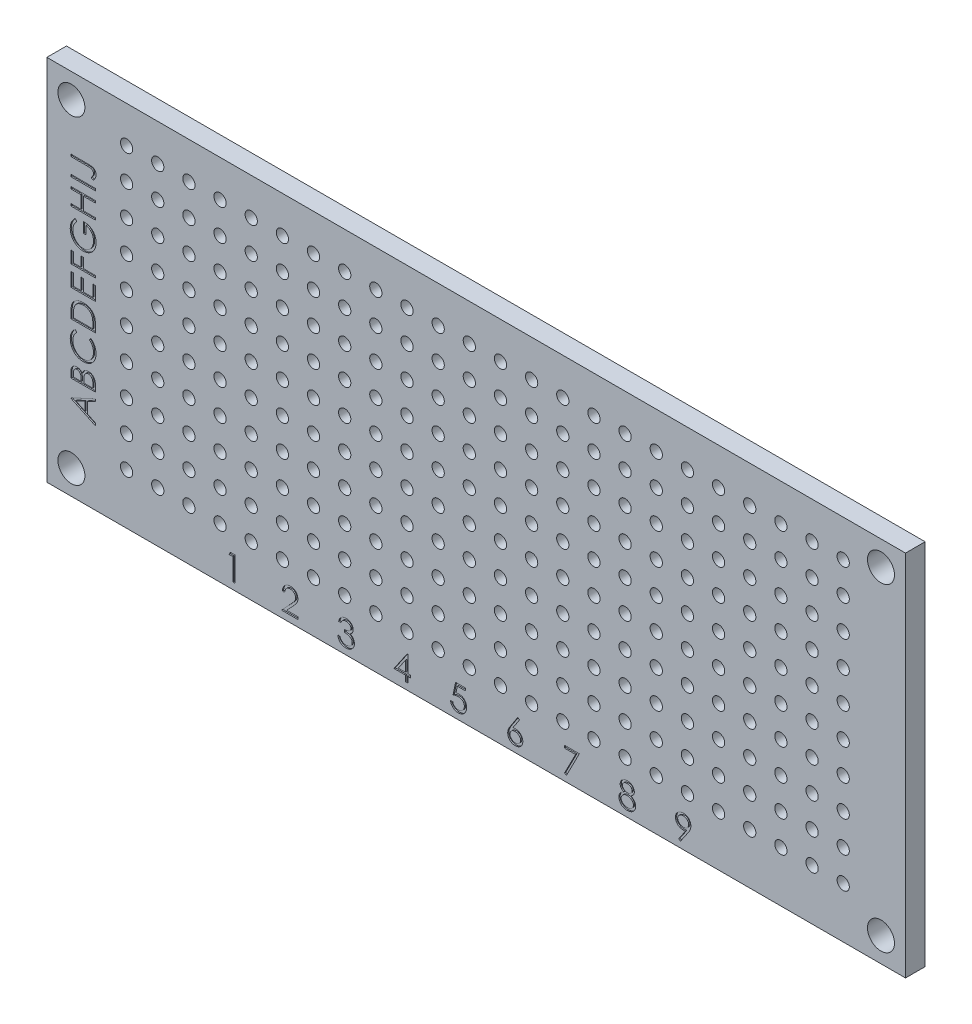
from build123d import *

# Parameters (mm, degrees)
SKICA1_W                 = 70
SKICA1_H                 = 30
SKICA1_R                 = 1.1
P_IDAT_VYSUNUT_M1_DEPTH  = 1.6
SKICA2_R                 = 0.5
ODEBRAT_VYSUNUT_M1_DEPTH = 1.6
SKICA4_W                 = 2
SKICA4_H                 = 0.17948718
ODEBRAT_VYSUNUT_M2_DEPTH = 0.1


with BuildPart() as part:
    # Skica1 → Přidat vysunutím1 (new body)
    with BuildSketch(Plane.XY):
        Rectangle(SKICA1_W, SKICA1_H)
        with Locations((-33, 13)):
            Circle(SKICA1_R, mode=Mode.SUBTRACT)
        with Locations((33, 13)):
            Circle(SKICA1_R, mode=Mode.SUBTRACT)
        with Locations((33, -13)):
            Circle(SKICA1_R, mode=Mode.SUBTRACT)
        with Locations((-33, -13)):
            Circle(SKICA1_R, mode=Mode.SUBTRACT)
    extrude(amount=P_IDAT_VYSUNUT_M1_DEPTH)

    # Skica2 → Odebrat vysunutím1 (cut)
    with BuildSketch(Plane.XY.offset(1.6)):
        with Locations((-28.5, 12)):
            Circle(SKICA2_R)
        with Locations((-25.96, 12)):
            Circle(SKICA2_R)
        with Locations((-23.42, 12)):
            Circle(SKICA2_R)
        with Locations((-20.88, 12)):
            Circle(SKICA2_R)
        with Locations((-18.34, 12)):
            Circle(SKICA2_R)
        with Locations((-15.8, 12)):
            Circle(SKICA2_R)
        with Locations((-13.26, 12)):
            Circle(SKICA2_R)
        with Locations((-10.72, 12)):
            Circle(SKICA2_R)
        with Locations((-8.18, 12)):
            Circle(SKICA2_R)
        with Locations((-5.64, 12)):
            Circle(SKICA2_R)
        with Locations((-3.1, 12)):
            Circle(SKICA2_R)
        with Locations((-0.56, 12)):
            Circle(SKICA2_R)
        with Locations((1.98, 12)):
            Circle(SKICA2_R)
        with Locations((4.52, 12)):
            Circle(SKICA2_R)
        with Locations((7.06, 12)):
            Circle(SKICA2_R)
        with Locations((9.6, 12)):
            Circle(SKICA2_R)
        with Locations((12.14, 12)):
            Circle(SKICA2_R)
        with Locations((14.68, 12)):
            Circle(SKICA2_R)
        with Locations((17.22, 12)):
            Circle(SKICA2_R)
        with Locations((19.76, 12)):
            Circle(SKICA2_R)
        with Locations((22.3, 12)):
            Circle(SKICA2_R)
        with Locations((24.84, 12)):
            Circle(SKICA2_R)
        with Locations((27.38, 12)):
            Circle(SKICA2_R)
        with Locations((29.92, 12)):
            Circle(SKICA2_R)
        with Locations((-25.96, 9.46)):
            Circle(SKICA2_R)
        with Locations((-23.42, 9.46)):
            Circle(SKICA2_R)
        with Locations((-20.88, 9.46)):
            Circle(SKICA2_R)
        with Locations((-18.34, 9.46)):
            Circle(SKICA2_R)
        with Locations((-15.8, 9.46)):
            Circle(SKICA2_R)
        with Locations((-13.26, 9.46)):
            Circle(SKICA2_R)
        with Locations((-10.72, 9.46)):
            Circle(SKICA2_R)
        with Locations((-8.18, 9.46)):
            Circle(SKICA2_R)
        with Locations((-5.64, 9.46)):
            Circle(SKICA2_R)
        with Locations((-3.1, 9.46)):
            Circle(SKICA2_R)
        with Locations((-0.56, 9.46)):
            Circle(SKICA2_R)
        with Locations((1.98, 9.46)):
            Circle(SKICA2_R)
        with Locations((4.52, 9.46)):
            Circle(SKICA2_R)
        with Locations((7.06, 9.46)):
            Circle(SKICA2_R)
        with Locations((9.6, 9.46)):
            Circle(SKICA2_R)
        with Locations((12.14, 9.46)):
            Circle(SKICA2_R)
        with Locations((14.68, 9.46)):
            Circle(SKICA2_R)
        with Locations((17.22, 9.46)):
            Circle(SKICA2_R)
        with Locations((19.76, 9.46)):
            Circle(SKICA2_R)
        with Locations((22.3, 9.46)):
            Circle(SKICA2_R)
        with Locations((24.84, 9.46)):
            Circle(SKICA2_R)
        with Locations((27.38, 9.46)):
            Circle(SKICA2_R)
        with Locations((29.92, 9.46)):
            Circle(SKICA2_R)
        with Locations((-25.96, 6.92)):
            Circle(SKICA2_R)
        with Locations((-23.42, 6.92)):
            Circle(SKICA2_R)
        with Locations((-20.88, 6.92)):
            Circle(SKICA2_R)
        with Locations((-18.34, 6.92)):
            Circle(SKICA2_R)
        with Locations((-15.8, 6.92)):
            Circle(SKICA2_R)
        with Locations((-13.26, 6.92)):
            Circle(SKICA2_R)
        with Locations((-10.72, 6.92)):
            Circle(SKICA2_R)
        with Locations((-8.18, 6.92)):
            Circle(SKICA2_R)
        with Locations((-5.64, 6.92)):
            Circle(SKICA2_R)
        with Locations((-3.1, 6.92)):
            Circle(SKICA2_R)
        with Locations((-0.56, 6.92)):
            Circle(SKICA2_R)
        with Locations((1.98, 6.92)):
            Circle(SKICA2_R)
        with Locations((4.52, 6.92)):
            Circle(SKICA2_R)
        with Locations((7.06, 6.92)):
            Circle(SKICA2_R)
        with Locations((9.6, 6.92)):
            Circle(SKICA2_R)
        with Locations((12.14, 6.92)):
            Circle(SKICA2_R)
        with Locations((14.68, 6.92)):
            Circle(SKICA2_R)
        with Locations((17.22, 6.92)):
            Circle(SKICA2_R)
        with Locations((19.76, 6.92)):
            Circle(SKICA2_R)
        with Locations((22.3, 6.92)):
            Circle(SKICA2_R)
        with Locations((24.84, 6.92)):
            Circle(SKICA2_R)
        with Locations((27.38, 6.92)):
            Circle(SKICA2_R)
        with Locations((29.92, 6.92)):
            Circle(SKICA2_R)
        with Locations((-25.96, 4.38)):
            Circle(SKICA2_R)
        with Locations((-23.42, 4.38)):
            Circle(SKICA2_R)
        with Locations((-20.88, 4.38)):
            Circle(SKICA2_R)
        with Locations((-18.34, 4.38)):
            Circle(SKICA2_R)
        with Locations((-15.8, 4.38)):
            Circle(SKICA2_R)
        with Locations((-13.26, 4.38)):
            Circle(SKICA2_R)
        with Locations((-10.72, 4.38)):
            Circle(SKICA2_R)
        with Locations((-8.18, 4.38)):
            Circle(SKICA2_R)
        with Locations((-5.64, 4.38)):
            Circle(SKICA2_R)
        with Locations((-3.1, 4.38)):
            Circle(SKICA2_R)
        with Locations((-0.56, 4.38)):
            Circle(SKICA2_R)
        with Locations((1.98, 4.38)):
            Circle(SKICA2_R)
        with Locations((4.52, 4.38)):
            Circle(SKICA2_R)
        with Locations((7.06, 4.38)):
            Circle(SKICA2_R)
        with Locations((9.6, 4.38)):
            Circle(SKICA2_R)
        with Locations((12.14, 4.38)):
            Circle(SKICA2_R)
        with Locations((14.68, 4.38)):
            Circle(SKICA2_R)
        with Locations((17.22, 4.38)):
            Circle(SKICA2_R)
        with Locations((19.76, 4.38)):
            Circle(SKICA2_R)
        with Locations((22.3, 4.38)):
            Circle(SKICA2_R)
        with Locations((24.84, 4.38)):
            Circle(SKICA2_R)
        with Locations((27.38, 4.38)):
            Circle(SKICA2_R)
        with Locations((29.92, 4.38)):
            Circle(SKICA2_R)
        with Locations((-25.96, 1.84)):
            Circle(SKICA2_R)
        with Locations((-23.42, 1.84)):
            Circle(SKICA2_R)
        with Locations((-20.88, 1.84)):
            Circle(SKICA2_R)
        with Locations((-18.34, 1.84)):
            Circle(SKICA2_R)
        with Locations((-15.8, 1.84)):
            Circle(SKICA2_R)
        with Locations((-13.26, 1.84)):
            Circle(SKICA2_R)
        with Locations((-10.72, 1.84)):
            Circle(SKICA2_R)
        with Locations((-8.18, 1.84)):
            Circle(SKICA2_R)
        with Locations((-5.64, 1.84)):
            Circle(SKICA2_R)
        with Locations((-3.1, 1.84)):
            Circle(SKICA2_R)
        with Locations((-0.56, 1.84)):
            Circle(SKICA2_R)
        with Locations((1.98, 1.84)):
            Circle(SKICA2_R)
        with Locations((4.52, 1.84)):
            Circle(SKICA2_R)
        with Locations((7.06, 1.84)):
            Circle(SKICA2_R)
        with Locations((9.6, 1.84)):
            Circle(SKICA2_R)
        with Locations((12.14, 1.84)):
            Circle(SKICA2_R)
        with Locations((14.68, 1.84)):
            Circle(SKICA2_R)
        with Locations((17.22, 1.84)):
            Circle(SKICA2_R)
        with Locations((19.76, 1.84)):
            Circle(SKICA2_R)
        with Locations((22.3, 1.84)):
            Circle(SKICA2_R)
        with Locations((24.84, 1.84)):
            Circle(SKICA2_R)
        with Locations((27.38, 1.84)):
            Circle(SKICA2_R)
        with Locations((29.92, 1.84)):
            Circle(SKICA2_R)
        with Locations((-25.96, -0.7)):
            Circle(SKICA2_R)
        with Locations((-23.42, -0.7)):
            Circle(SKICA2_R)
        with Locations((-20.88, -0.7)):
            Circle(SKICA2_R)
        with Locations((-18.34, -0.7)):
            Circle(SKICA2_R)
        with Locations((-15.8, -0.7)):
            Circle(SKICA2_R)
        with Locations((-13.26, -0.7)):
            Circle(SKICA2_R)
        with Locations((-10.72, -0.7)):
            Circle(SKICA2_R)
        with Locations((-8.18, -0.7)):
            Circle(SKICA2_R)
        with Locations((-5.64, -0.7)):
            Circle(SKICA2_R)
        with Locations((-3.1, -0.7)):
            Circle(SKICA2_R)
        with Locations((-0.56, -0.7)):
            Circle(SKICA2_R)
        with Locations((1.98, -0.7)):
            Circle(SKICA2_R)
        with Locations((4.52, -0.7)):
            Circle(SKICA2_R)
        with Locations((7.06, -0.7)):
            Circle(SKICA2_R)
        with Locations((9.6, -0.7)):
            Circle(SKICA2_R)
        with Locations((12.14, -0.7)):
            Circle(SKICA2_R)
        with Locations((14.68, -0.7)):
            Circle(SKICA2_R)
        with Locations((17.22, -0.7)):
            Circle(SKICA2_R)
        with Locations((19.76, -0.7)):
            Circle(SKICA2_R)
        with Locations((22.3, -0.7)):
            Circle(SKICA2_R)
        with Locations((24.84, -0.7)):
            Circle(SKICA2_R)
        with Locations((27.38, -0.7)):
            Circle(SKICA2_R)
        with Locations((29.92, -0.7)):
            Circle(SKICA2_R)
        with Locations((-25.96, -3.24)):
            Circle(SKICA2_R)
        with Locations((-23.42, -3.24)):
            Circle(SKICA2_R)
        with Locations((-20.88, -3.24)):
            Circle(SKICA2_R)
        with Locations((-18.34, -3.24)):
            Circle(SKICA2_R)
        with Locations((-15.8, -3.24)):
            Circle(SKICA2_R)
        with Locations((-13.26, -3.24)):
            Circle(SKICA2_R)
        with Locations((-10.72, -3.24)):
            Circle(SKICA2_R)
        with Locations((-8.18, -3.24)):
            Circle(SKICA2_R)
        with Locations((-5.64, -3.24)):
            Circle(SKICA2_R)
        with Locations((-3.1, -3.24)):
            Circle(SKICA2_R)
        with Locations((-0.56, -3.24)):
            Circle(SKICA2_R)
        with Locations((1.98, -3.24)):
            Circle(SKICA2_R)
        with Locations((4.52, -3.24)):
            Circle(SKICA2_R)
        with Locations((7.06, -3.24)):
            Circle(SKICA2_R)
        with Locations((9.6, -3.24)):
            Circle(SKICA2_R)
        with Locations((12.14, -3.24)):
            Circle(SKICA2_R)
        with Locations((14.68, -3.24)):
            Circle(SKICA2_R)
        with Locations((17.22, -3.24)):
            Circle(SKICA2_R)
        with Locations((19.76, -3.24)):
            Circle(SKICA2_R)
        with Locations((22.3, -3.24)):
            Circle(SKICA2_R)
        with Locations((24.84, -3.24)):
            Circle(SKICA2_R)
        with Locations((27.38, -3.24)):
            Circle(SKICA2_R)
        with Locations((29.92, -3.24)):
            Circle(SKICA2_R)
        with Locations((-25.96, -5.78)):
            Circle(SKICA2_R)
        with Locations((-23.42, -5.78)):
            Circle(SKICA2_R)
        with Locations((-20.88, -5.78)):
            Circle(SKICA2_R)
        with Locations((-18.34, -5.78)):
            Circle(SKICA2_R)
        with Locations((-15.8, -5.78)):
            Circle(SKICA2_R)
        with Locations((-13.26, -5.78)):
            Circle(SKICA2_R)
        with Locations((-10.72, -5.78)):
            Circle(SKICA2_R)
        with Locations((-8.18, -5.78)):
            Circle(SKICA2_R)
        with Locations((-5.64, -5.78)):
            Circle(SKICA2_R)
        with Locations((-3.1, -5.78)):
            Circle(SKICA2_R)
        with Locations((-0.56, -5.78)):
            Circle(SKICA2_R)
        with Locations((1.98, -5.78)):
            Circle(SKICA2_R)
        with Locations((4.52, -5.78)):
            Circle(SKICA2_R)
        with Locations((7.06, -5.78)):
            Circle(SKICA2_R)
        with Locations((9.6, -5.78)):
            Circle(SKICA2_R)
        with Locations((12.14, -5.78)):
            Circle(SKICA2_R)
        with Locations((14.68, -5.78)):
            Circle(SKICA2_R)
        with Locations((17.22, -5.78)):
            Circle(SKICA2_R)
        with Locations((19.76, -5.78)):
            Circle(SKICA2_R)
        with Locations((22.3, -5.78)):
            Circle(SKICA2_R)
        with Locations((24.84, -5.78)):
            Circle(SKICA2_R)
        with Locations((27.38, -5.78)):
            Circle(SKICA2_R)
        with Locations((29.92, -5.78)):
            Circle(SKICA2_R)
        with Locations((-25.96, -8.32)):
            Circle(SKICA2_R)
        with Locations((-23.42, -8.32)):
            Circle(SKICA2_R)
        with Locations((-20.88, -8.32)):
            Circle(SKICA2_R)
        with Locations((-18.34, -8.32)):
            Circle(SKICA2_R)
        with Locations((-15.8, -8.32)):
            Circle(SKICA2_R)
        with Locations((-13.26, -8.32)):
            Circle(SKICA2_R)
        with Locations((-10.72, -8.32)):
            Circle(SKICA2_R)
        with Locations((-8.18, -8.32)):
            Circle(SKICA2_R)
        with Locations((-5.64, -8.32)):
            Circle(SKICA2_R)
        with Locations((-3.1, -8.32)):
            Circle(SKICA2_R)
        with Locations((-0.56, -8.32)):
            Circle(SKICA2_R)
        with Locations((1.98, -8.32)):
            Circle(SKICA2_R)
        with Locations((4.52, -8.32)):
            Circle(SKICA2_R)
        with Locations((7.06, -8.32)):
            Circle(SKICA2_R)
        with Locations((9.6, -8.32)):
            Circle(SKICA2_R)
        with Locations((12.14, -8.32)):
            Circle(SKICA2_R)
        with Locations((14.68, -8.32)):
            Circle(SKICA2_R)
        with Locations((17.22, -8.32)):
            Circle(SKICA2_R)
        with Locations((19.76, -8.32)):
            Circle(SKICA2_R)
        with Locations((22.3, -8.32)):
            Circle(SKICA2_R)
        with Locations((24.84, -8.32)):
            Circle(SKICA2_R)
        with Locations((27.38, -8.32)):
            Circle(SKICA2_R)
        with Locations((29.92, -8.32)):
            Circle(SKICA2_R)
        with Locations((-25.96, -10.86)):
            Circle(SKICA2_R)
        with Locations((-23.42, -10.86)):
            Circle(SKICA2_R)
        with Locations((-20.88, -10.86)):
            Circle(SKICA2_R)
        with Locations((-18.34, -10.86)):
            Circle(SKICA2_R)
        with Locations((-15.8, -10.86)):
            Circle(SKICA2_R)
        with Locations((-13.26, -10.86)):
            Circle(SKICA2_R)
        with Locations((-10.72, -10.86)):
            Circle(SKICA2_R)
        with Locations((-8.18, -10.86)):
            Circle(SKICA2_R)
        with Locations((-5.64, -10.86)):
            Circle(SKICA2_R)
        with Locations((-3.1, -10.86)):
            Circle(SKICA2_R)
        with Locations((-0.56, -10.86)):
            Circle(SKICA2_R)
        with Locations((1.98, -10.86)):
            Circle(SKICA2_R)
        with Locations((4.52, -10.86)):
            Circle(SKICA2_R)
        with Locations((7.06, -10.86)):
            Circle(SKICA2_R)
        with Locations((9.6, -10.86)):
            Circle(SKICA2_R)
        with Locations((12.14, -10.86)):
            Circle(SKICA2_R)
        with Locations((14.68, -10.86)):
            Circle(SKICA2_R)
        with Locations((17.22, -10.86)):
            Circle(SKICA2_R)
        with Locations((19.76, -10.86)):
            Circle(SKICA2_R)
        with Locations((22.3, -10.86)):
            Circle(SKICA2_R)
        with Locations((24.84, -10.86)):
            Circle(SKICA2_R)
        with Locations((27.38, -10.86)):
            Circle(SKICA2_R)
        with Locations((29.92, -10.86)):
            Circle(SKICA2_R)
        with Locations((-28.5, 9.46)):
            Circle(SKICA2_R)
        with Locations((-28.5, 6.92)):
            Circle(SKICA2_R)
        with Locations((-28.5, 4.38)):
            Circle(SKICA2_R)
        with Locations((-28.5, 1.84)):
            Circle(SKICA2_R)
        with Locations((-28.5, -0.7)):
            Circle(SKICA2_R)
        with Locations((-28.5, -3.24)):
            Circle(SKICA2_R)
        with Locations((-28.5, -5.78)):
            Circle(SKICA2_R)
        with Locations((-28.5, -8.32)):
            Circle(SKICA2_R)
        with Locations((-28.5, -10.86)):
            Circle(SKICA2_R)
    extrude(amount=-ODEBRAT_VYSUNUT_M1_DEPTH, mode=Mode.SUBTRACT)

    # Skica4 → Odebrat vysunutím2 (cut)
    # profile 1 of 19: a face of its own
    with BuildSketch(Plane.XY.offset(1.6)):
        Polygon((-20.030425572, -12.459324184), (-19.660633905, -12.459324184), (-19.660633905, -14.459324184), (-19.840121085, -14.459324184), (-19.840121085, -12.664452389), (-20.147813392, -12.664452389), align=None)
    # profile 2 of 19: a face of its own
    with BuildSketch(Plane.XY.offset(1.6)):
        with BuildLine():
            Line((-15.614480059, -13.074708799), (-15.793967238, -13.074708799))
            add(Edge.make_bspline(
                [(-15.793967238, -13.074708799), (-15.792797437, -13.050896863), (-15.790499977, -13.004130855), (-15.779740955, -12.935945766), (-15.764346168, -12.870771595), (-15.742579623, -12.809131644), (-15.715547464, -12.750480897), (-15.683130305, -12.695052317), (-15.644733819, -12.643057352), (-15.601187114, -12.594978013), (-15.553890749, -12.550870829), (-15.502858784, -12.512782119), (-15.449233054, -12.480600593), (-15.393176254, -12.453697026), (-15.334055932, -12.433502828), (-15.272408585, -12.418519034), (-15.207963364, -12.409503979), (-15.16405478, -12.408534959), (-15.141723649, -12.408042132)],
                knots=[0, 0, 0, 0, 1.10065271, 2.161652631, 3.183658789, 4.190468796, 5.17591951, 6.163126047, 7.15150782, 8.156236427, 9.156009102, 10.134482811, 11.092018607, 12.041330605, 13.001268258, 13.972401359, 14.968799086, 16, 16, 16, 16], degree=3))
            add(Edge.make_bspline(
                [(-15.141723649, -12.408042132), (-15.119793321, -12.408555536), (-15.076701009, -12.409564356), (-15.01380843, -12.418227801), (-14.95393569, -12.431796711), (-14.897199823, -12.450834092), (-14.844053501, -12.476425193), (-14.794097475, -12.507166644), (-14.746737012, -12.542720833), (-14.704104564, -12.584580155), (-14.66495709, -12.629267232), (-14.631184373, -12.676974605), (-14.602262565, -12.726248483), (-14.57815532, -12.777464598), (-14.560408955, -12.831105186), (-14.546935693, -12.886389302), (-14.539320028, -12.943889194), (-14.538151215, -12.982807225), (-14.537556982, -13.002593415)],
                knots=[0, 0, 0, 0, 1.111607364, 2.184268762, 3.212621178, 4.221274766, 5.211760367, 6.196651075, 7.1921475, 8.207485113, 9.220403448, 10.201281604, 11.166441695, 12.114753415, 13.065576456, 14.026450734, 14.996634279, 16, 16, 16, 16], degree=3))
            add(Edge.make_bspline(
                [(-14.537556982, -13.002593415), (-14.538524561, -13.03044932), (-14.540442739, -13.085672299), (-14.556850954, -13.166823649), (-14.582477532, -13.24544846), (-14.613333164, -13.308726919), (-14.644460275, -13.359717486), (-14.672510279, -13.401699604), (-14.705347314, -13.446902728), (-14.743449313, -13.495175493), (-14.786028097, -13.54689601), (-14.833469333, -13.602033036), (-14.886111323, -13.660016904), (-14.923059038, -13.699620105), (-14.942204418, -13.720141491)],
                knots=[0, 0, 0, 0, 1.184426356, 2.348067706, 3.509069118, 4.696110526, 5.333549288, 6.050745305, 6.844228056, 7.710549037, 8.667450064, 9.695053472, 10.805634456, 12, 12, 12, 12], degree=3))
            Line((-14.942204418, -13.720141491), (-15.442605059, -14.254195979))
            Line((-15.442605059, -14.254195979), (-14.511915956, -14.254195979))
            Line((-14.511915956, -14.254195979), (-14.511915956, -14.459324184))
            Line((-14.511915956, -14.459324184), (-15.870890315, -14.459324184))
            Line((-15.870890315, -14.459324184), (-15.09524929, -13.631599825))
            add(Edge.make_bspline(
                [(-15.09524929, -13.631599825), (-15.076364783, -13.611886507), (-15.04009151, -13.574021257), (-14.988787181, -13.518739566), (-14.942707759, -13.467454114), (-14.901554963, -13.420261801), (-14.866221531, -13.376472333), (-14.83486597, -13.337503931), (-14.809742775, -13.301644245), (-14.782476835, -13.26007818), (-14.756068846, -13.209328285), (-14.733376071, -13.147309034), (-14.719539014, -13.083464889), (-14.717879108, -13.040320868), (-14.717044161, -13.018619056)],
                knots=[0, 0, 0, 0, 1.329631726, 2.553950428, 3.673215718, 4.687767853, 5.603093632, 6.413772471, 7.123043292, 7.734684054, 8.834405432, 9.900288307, 10.943827018, 12, 12, 12, 12], degree=3))
            add(Edge.make_bspline(
                [(-14.717044161, -13.018619056), (-14.717407443, -13.004972542), (-14.7181234, -12.978077885), (-14.724442085, -12.938646023), (-14.733990945, -12.900608986), (-14.74767395, -12.863849775), (-14.765734944, -12.828737974), (-14.787719733, -12.795230842), (-14.813085483, -12.762837148), (-14.842429066, -12.732463835), (-14.87466422, -12.704646003), (-14.908718077, -12.680003669), (-14.944746708, -12.659409891), (-14.982598206, -12.642527893), (-15.022167046, -12.629284818), (-15.063529757, -12.620108487), (-15.106572052, -12.614347067), (-15.135962621, -12.61356754), (-15.150938392, -12.613170338)],
                knots=[0, 0, 0, 0, 0.991446411, 1.95395049, 2.89581595, 3.838931463, 4.798493298, 5.75982156, 6.748411868, 7.785213223, 8.824556874, 9.840280684, 10.836137867, 11.835679398, 12.848801643, 13.863922112, 14.911575587, 16, 16, 16, 16], degree=3))
            add(Edge.make_bspline(
                [(-15.150938392, -12.613170338), (-15.166578868, -12.613578927), (-15.19729418, -12.614381331), (-15.24239077, -12.619994281), (-15.285411215, -12.629677619), (-15.326463731, -12.642921433), (-15.36561778, -12.659754889), (-15.402682948, -12.6807216), (-15.437576027, -12.705740739), (-15.470362612, -12.734106772), (-15.5005706, -12.765688258), (-15.527111672, -12.800893951), (-15.550302537, -12.839081046), (-15.570536385, -12.880146503), (-15.586968208, -12.924462949), (-15.599524294, -12.971873066), (-15.609459635, -13.022170998), (-15.612778789, -13.056905332), (-15.614480059, -13.074708799)],
                knots=[0, 0, 0, 0, 1.031018746, 2.02475058, 2.990194455, 3.934040569, 4.864654155, 5.795059489, 6.735614925, 7.690564532, 8.649604399, 9.611025574, 10.590972636, 11.591080095, 12.624614302, 13.701020113, 14.821632451, 16, 16, 16, 16], degree=3))
        make_face()
    # profile 3 of 19: a face of its own
    with BuildSketch(Plane.XY.offset(1.6)):
        with BuildLine():
            Line((-11.029864674, -12.920862645), (-11.209351854, -12.920862645))
            add(Edge.make_bspline(
                [(-11.209351854, -12.920862645), (-11.204489253, -12.900729797), (-11.194983267, -12.861371726), (-11.175156082, -12.805139006), (-11.153556508, -12.751925565), (-11.127619877, -12.702727809), (-11.09932916, -12.656557007), (-11.066916176, -12.614460364), (-11.031876335, -12.575367241), (-10.993119221, -12.540673963), (-10.952474272, -12.509258117), (-10.909368775, -12.48247237), (-10.864669978, -12.459429997), (-10.818068188, -12.440447008), (-10.769424661, -12.426146708), (-10.719179162, -12.415771391), (-10.667200019, -12.409033611), (-10.631915682, -12.408376033), (-10.61399929, -12.408042132)],
                knots=[0, 0, 0, 0, 1.162005537, 2.271625781, 3.343758855, 4.383309926, 5.390229558, 6.379919256, 7.361854164, 8.333198761, 9.295911338, 10.242430842, 11.177959212, 12.116337295, 13.062827104, 14.020064771, 14.994644689, 16, 16, 16, 16], degree=3))
            add(Edge.make_bspline(
                [(-10.61399929, -12.408042132), (-10.587894866, -12.408830264), (-10.536255431, -12.410389336), (-10.460390833, -12.424626157), (-10.38723265, -12.447154804), (-10.317581651, -12.478282648), (-10.252885404, -12.516675398), (-10.195321869, -12.562369533), (-10.145671291, -12.61448342), (-10.104017361, -12.672044885), (-10.071403076, -12.733562319), (-10.04735372, -12.796876695), (-10.032712759, -12.861837821), (-10.030815298, -12.905699124), (-10.029864674, -12.927673543)],
                knots=[0, 0, 0, 0, 1.083050992, 2.142477498, 3.193116406, 4.255571735, 5.30263384, 6.308962982, 7.297363603, 8.282367274, 9.249857812, 10.179914175, 11.08814088, 12, 12, 12, 12], degree=3))
            add(Edge.make_bspline(
                [(-10.029864674, -12.927673543), (-10.030529583, -12.948820283), (-10.031830707, -12.990201171), (-10.042878539, -13.050613455), (-10.061470689, -13.107551512), (-10.08722484, -13.161255033), (-10.120562868, -13.211383513), (-10.160947266, -13.258049737), (-10.208663073, -13.301460684), (-10.244822466, -13.326328954), (-10.263438392, -13.339131876)],
                knots=[0, 0, 0, 0, 1.024540389, 2.004866551, 2.965041327, 3.920577974, 4.882998113, 5.874504559, 6.905732034, 8, 8, 8, 8], degree=3))
            add(Edge.make_bspline(
                [(-10.263438392, -13.339131876), (-10.242163104, -13.349405117), (-10.200010604, -13.369759378), (-10.142553159, -13.409676954), (-10.090394373, -13.455766296), (-10.061306534, -13.491733526), (-10.046691597, -13.509804953)],
                knots=[0, 0, 0, 0, 1.015518401, 2.012035669, 3.001164323, 4, 4, 4, 4], degree=3))
            add(Edge.make_bspline(
                [(-10.046691597, -13.509804953), (-10.037067973, -13.522980811), (-10.017978318, -13.549116763), (-9.994415156, -13.591137578), (-9.973038519, -13.633624143), (-9.956381251, -13.677715233), (-9.943481899, -13.722899812), (-9.934261309, -13.769255467), (-9.928533228, -13.816820051), (-9.927712913, -13.848998611), (-9.927300572, -13.865173543)],
                knots=[0, 0, 0, 0, 1.025084078, 2.033381695, 3.024893161, 4.013698104, 4.991890475, 5.976764909, 6.982997093, 8, 8, 8, 8], degree=3))
            add(Edge.make_bspline(
                [(-9.927300572, -13.865173543), (-9.928326008, -13.893179098), (-9.930372055, -13.949058413), (-9.948660097, -14.031615397), (-9.977010521, -14.112315684), (-10.017271627, -14.189501306), (-10.066338775, -14.261718667), (-10.124714389, -14.326333701), (-10.191735193, -14.38187576), (-10.266481278, -14.428281605), (-10.347462495, -14.46537756), (-10.434077119, -14.491124671), (-10.52507715, -14.507893813), (-10.58748132, -14.509692024), (-10.619207623, -14.510606235)],
                knots=[0, 0, 0, 0, 0.955779014, 1.907060117, 2.875433937, 3.871313158, 4.872415639, 5.851225146, 6.836215519, 7.83643374, 8.849228613, 9.86973379, 10.916971861, 12, 12, 12, 12], degree=3))
            add(Edge.make_bspline(
                [(-10.619207623, -14.510606235), (-10.64059008, -14.510110113), (-10.682663626, -14.509133911), (-10.744517054, -14.502460424), (-10.803558025, -14.49027185), (-10.859866366, -14.473869961), (-10.913492101, -14.45307468), (-10.96427159, -14.427178281), (-11.012517244, -14.396714566), (-11.057773787, -14.361323944), (-11.100035826, -14.321734607), (-11.13818024, -14.277243744), (-11.172842978, -14.228673799), (-11.203095915, -14.175460624), (-11.230317031, -14.118291906), (-11.252706149, -14.056435621), (-11.272412188, -13.990444751), (-11.281574168, -13.944457471), (-11.286274931, -13.920862645)],
                knots=[0, 0, 0, 0, 1.048658725, 2.063410685, 3.046034179, 4.001477787, 4.936774919, 5.862367409, 6.792675028, 7.730719943, 8.675894397, 9.627829632, 10.600096036, 11.597688215, 12.626045268, 13.701542398, 14.82072376, 16, 16, 16, 16], degree=3))
            Line((-11.286274931, -13.920862645), (-11.106787751, -13.920862645))
            add(Edge.make_bspline(
                [(-11.106787751, -13.920862645), (-11.102111585, -13.936262081), (-11.093016035, -13.966215322), (-11.077533579, -14.009324068), (-11.059894566, -14.048842956), (-11.040971961, -14.085061883), (-11.021098563, -14.118337541), (-10.998861463, -14.147790038), (-10.975907666, -14.174713011), (-10.958605178, -14.18988136), (-10.95013711, -14.197304953)],
                knots=[0, 0, 0, 0, 1.198163088, 2.33053128, 3.407730985, 4.417276592, 5.372219308, 6.28897303, 7.162600585, 8, 8, 8, 8], degree=3))
            add(Edge.make_bspline(
                [(-10.95013711, -14.197304953), (-10.938939066, -14.205938287), (-10.916577545, -14.223178305), (-10.880138556, -14.245179235), (-10.841815764, -14.264242678), (-10.800778807, -14.27880479), (-10.757913224, -14.291134882), (-10.712526158, -14.29920375), (-10.665018034, -14.304739848), (-10.632579312, -14.30522838), (-10.616002495, -14.30547803)],
                knots=[0, 0, 0, 0, 0.946170439, 1.889420265, 2.845303464, 3.807233317, 4.801018734, 5.828864929, 6.890507805, 8, 8, 8, 8], degree=3))
            add(Edge.make_bspline(
                [(-10.616002495, -14.30547803), (-10.597286208, -14.305126084), (-10.560688124, -14.304437884), (-10.507285347, -14.298108909), (-10.456481091, -14.28889153), (-10.408839419, -14.27465554), (-10.363736272, -14.257066482), (-10.321803901, -14.234981679), (-10.28249184, -14.209070409), (-10.246303609, -14.179619461), (-10.213763319, -14.147378607), (-10.185112168, -14.113656852), (-10.160755219, -14.078596378), (-10.14110746, -14.042003166), (-10.12559286, -14.00402875), (-10.115031031, -13.964566561), (-10.107687308, -13.923939552), (-10.107089244, -13.896322998), (-10.106787751, -13.882401107)],
                knots=[0, 0, 0, 0, 1.217147791, 2.380027433, 3.494444702, 4.572153297, 5.609568379, 6.639424714, 7.649109417, 8.668170816, 9.669597737, 10.625200337, 11.543417969, 12.441394052, 13.322311151, 14.205496177, 15.095365482, 16, 16, 16, 16], degree=3))
            add(Edge.make_bspline(
                [(-10.106787751, -13.882401107), (-10.107662209, -13.863766056), (-10.109406774, -13.82658868), (-10.122725962, -13.771892923), (-10.144633885, -13.71919383), (-10.175303891, -13.669390522), (-10.212638593, -13.623232864), (-10.256275683, -13.582049159), (-10.306577528, -13.54806625), (-10.352874596, -13.524587018), (-10.393883257, -13.508565832), (-10.428977762, -13.497894424), (-10.46826725, -13.488858049), (-10.511276592, -13.480451037), (-10.558329858, -13.473295981), (-10.609375823, -13.467329229), (-10.66442483, -13.46255492), (-10.702534067, -13.460422866), (-10.722172367, -13.459324184)],
                knots=[0, 0, 0, 0, 1.07054697, 2.135767047, 3.216561865, 4.33974944, 5.486079747, 6.621378074, 7.775625952, 8.963672916, 9.598146892, 10.304877434, 11.070270905, 11.915000392, 12.823868403, 13.805723172, 14.86925407, 16, 16, 16, 16], degree=3))
            Line((-10.722172367, -13.459324184), (-10.722172367, -13.254195979))
            add(Edge.make_bspline(
                [(-10.722172367, -13.254195979), (-10.697428843, -13.253776091), (-10.64896236, -13.252953634), (-10.578165614, -13.243006199), (-10.510466578, -13.22924584), (-10.447365583, -13.208168588), (-10.389852033, -13.183688418), (-10.339955117, -13.155201441), (-10.29837389, -13.12353587), (-10.265310421, -13.08820295), (-10.240436576, -13.050308638), (-10.222249834, -13.010813405), (-10.211506791, -12.969371084), (-10.210072695, -12.941088417), (-10.209351854, -12.926872261)],
                knots=[0, 0, 0, 0, 1.321986639, 2.589447074, 3.816329219, 5.01088745, 6.139805852, 7.153945165, 8.075214402, 8.924034688, 9.728124013, 10.488707548, 11.240355623, 12, 12, 12, 12], degree=3))
            add(Edge.make_bspline(
                [(-10.209351854, -12.926872261), (-10.20958866, -12.916427835), (-10.210059775, -12.895649145), (-10.216001076, -12.865291963), (-10.2249291, -12.835862851), (-10.237203231, -12.807486959), (-10.253631916, -12.780361089), (-10.27329248, -12.754253975), (-10.296702823, -12.729314673), (-10.323528792, -12.706068776), (-10.352335538, -12.683914926), (-10.383906838, -12.665107133), (-10.417290766, -12.649024241), (-10.452524284, -12.635761668), (-10.489721729, -12.625784932), (-10.528708334, -12.618621594), (-10.569558439, -12.614142934), (-10.597428, -12.613498125), (-10.611595443, -12.613170338)],
                knots=[0, 0, 0, 0, 0.884392785, 1.759457502, 2.611959086, 3.489218968, 4.37281399, 5.2945488, 6.255912374, 7.266815255, 8.301784654, 9.332968512, 10.37626691, 11.440494194, 12.520033166, 13.637162961, 14.798855837, 16, 16, 16, 16], degree=3))
            add(Edge.make_bspline(
                [(-10.611595443, -12.613170338), (-10.634367825, -12.613965402), (-10.678847583, -12.615518347), (-10.742970393, -12.629120069), (-10.802581441, -12.650821831), (-10.848146393, -12.676726413), (-10.881793578, -12.70229809), (-10.905837543, -12.724630882), (-10.929449263, -12.749449638), (-10.951075364, -12.778282995), (-10.972946208, -12.809178304), (-10.992857386, -12.843706122), (-11.012205782, -12.880965776), (-11.023864382, -12.907306139), (-11.029864674, -12.920862645)],
                knots=[0, 0, 0, 0, 1.472543308, 2.876219568, 4.221790263, 5.565193594, 6.249813518, 6.953379497, 7.687249741, 8.463570142, 9.283606569, 10.136032583, 11.040678096, 12, 12, 12, 12], degree=3))
        make_face()
    # profile 4 of 19: a face of its own
    with BuildSketch(Plane.XY.offset(1.6)):
        Polygon((-5.609912751, -12.408042132), (-5.573454418, -12.408042132), (-5.573454418, -13.792657517), (-5.342685187, -13.792657517), (-5.342685187, -13.997785722), (-5.573454418, -13.997785722), (-5.573454418, -14.459324184), (-5.752941597, -14.459324184), (-5.752941597, -13.997785722), (-6.701659546, -13.997785722), align=None)
        Polygon((-5.752941597, -13.792657517), (-5.752941597, -12.924067774), (-6.349095443, -13.792657517), align=None, mode=Mode.SUBTRACT)
    # profile 5 of 19: a face of its own
    with BuildSketch(Plane.XY.offset(1.6)):
        with BuildLine():
            Line((-0.860633905, -12.459324184), (-0.860633905, -12.664452389))
            Line((-0.860633905, -12.664452389), (-1.540922367, -12.664452389))
            Line((-1.540922367, -12.664452389), (-1.648694802, -13.190494056))
            add(Edge.make_bspline(
                [(-1.648694802, -13.190494056), (-1.627520017, -13.184648186), (-1.586497219, -13.173322738), (-1.525948728, -13.160748012), (-1.468467468, -13.153167758), (-1.431167257, -13.152132724), (-1.413117879, -13.151631876)],
                knots=[0, 0, 0, 0, 1.100273476, 2.13160584, 3.095893838, 4, 4, 4, 4], degree=3))
            add(Edge.make_bspline(
                [(-1.413117879, -13.151631876), (-1.390784314, -13.152115268), (-1.346870944, -13.153065737), (-1.282620117, -13.162192508), (-1.221287035, -13.176558174), (-1.162999967, -13.196627043), (-1.107651081, -13.222289748), (-1.055749617, -13.254346857), (-1.006516524, -13.291794474), (-0.960835041, -13.334848767), (-0.91939258, -13.382232548), (-0.882954871, -13.433179903), (-0.85200482, -13.48719571), (-0.82711296, -13.544796058), (-0.807236197, -13.605344145), (-0.794006486, -13.66947705), (-0.785196938, -13.736590261), (-0.784212717, -13.782478587), (-0.783710828, -13.805878671)],
                knots=[0, 0, 0, 0, 1.052922333, 2.070308379, 3.05430497, 4.020497103, 4.973039431, 5.925935799, 6.892292201, 7.88610001, 8.88166317, 9.857072816, 10.836096531, 11.812156883, 12.81219415, 13.836441305, 14.89672472, 16, 16, 16, 16], degree=3))
            add(Edge.make_bspline(
                [(-0.783710828, -13.805878671), (-0.784090871, -13.822177083), (-0.784845821, -13.854553647), (-0.788685014, -13.902636047), (-0.796076852, -13.949700523), (-0.806001266, -13.995753319), (-0.818882647, -14.040707246), (-0.834476392, -14.084690976), (-0.853559837, -14.127430751), (-0.874492051, -14.169330977), (-0.898061467, -14.20944441), (-0.924220614, -14.246958116), (-0.951858038, -14.282434848), (-0.981595972, -14.315494124), (-1.013710827, -14.345918706), (-1.047813665, -14.373889153), (-1.083632361, -14.399878484), (-1.121721071, -14.422831739), (-1.161231062, -14.443953428), (-1.2027329, -14.461281164), (-1.245281872, -14.476772894), (-1.289490372, -14.489121195), (-1.335258265, -14.498796941), (-1.382660994, -14.505368713), (-1.431449948, -14.510155248), (-1.464521384, -14.510454881), (-1.481226854, -14.510606235)],
                knots=[0, 0, 0, 0, 1.056347294, 2.098418968, 3.122841568, 4.141288669, 5.149314143, 6.15115421, 7.162517403, 8.180376062, 9.185164535, 10.17417709, 11.141909838, 12.097768115, 13.052685741, 14.0056014, 14.954263652, 15.917497458, 16.885230207, 17.854509472, 18.828990115, 19.81800267, 20.826176721, 21.857883937, 22.917946725, 24, 24, 24, 24], degree=3))
            add(Edge.make_bspline(
                [(-1.481226854, -14.510606235), (-1.501154957, -14.51021147), (-1.540361146, -14.509434818), (-1.59780147, -14.501309969), (-1.653066959, -14.489673445), (-1.705712731, -14.472167006), (-1.756210596, -14.450231409), (-1.803880721, -14.422507882), (-1.849941164, -14.391091251), (-1.892519471, -14.354016764), (-1.93203725, -14.313493517), (-1.967412398, -14.269517722), (-1.998917299, -14.222815184), (-2.02604744, -14.173159096), (-2.049189166, -14.120679935), (-2.06736916, -14.065181078), (-2.082042505, -14.006952504), (-2.088250174, -13.966864784), (-2.091403136, -13.946503671)],
                knots=[0, 0, 0, 0, 1.0467383, 2.05933395, 3.04377827, 4.011590433, 4.970194871, 5.932262533, 6.905835911, 7.896367577, 8.894135286, 9.877477877, 10.858688626, 11.851381753, 12.8477658, 13.868841284, 14.917554742, 16, 16, 16, 16], degree=3))
            Line((-2.091403136, -13.946503671), (-1.911915956, -13.946503671))
            add(Edge.make_bspline(
                [(-1.911915956, -13.946503671), (-1.907499638, -13.965575929), (-1.899011228, -14.002233869), (-1.880379372, -14.053737493), (-1.857598872, -14.099634192), (-1.830510673, -14.140531097), (-1.798196369, -14.176193381), (-1.76132241, -14.207974559), (-1.719980854, -14.236646062), (-1.674041866, -14.260544786), (-1.625577249, -14.280926931), (-1.574853129, -14.294499328), (-1.523250645, -14.304042695), (-1.488348719, -14.304997987), (-1.470810187, -14.30547803)],
                knots=[0, 0, 0, 0, 1.136247022, 2.183929868, 3.172523383, 4.106158343, 5.02341133, 5.958108904, 6.928429099, 7.938127109, 8.96079061, 9.975095812, 10.982467395, 12, 12, 12, 12], degree=3))
            add(Edge.make_bspline(
                [(-1.470810187, -14.30547803), (-1.453691076, -14.305009014), (-1.419983406, -14.304085518), (-1.370376899, -14.296977511), (-1.322483829, -14.286030327), (-1.276776768, -14.269647553), (-1.232455888, -14.249736285), (-1.190642305, -14.224184813), (-1.150126375, -14.194779089), (-1.112167441, -14.161089586), (-1.077402042, -14.123964046), (-1.046684258, -14.084262678), (-1.021097451, -14.041910194), (-0.999535103, -13.997639821), (-0.983161789, -13.95096636), (-0.971481228, -13.902108546), (-0.964622338, -13.8509457), (-0.963678806, -13.816048952), (-0.963198008, -13.798266491)],
                knots=[0, 0, 0, 0, 1.027316725, 2.022795036, 3.002884548, 3.971462791, 4.93288096, 5.914575861, 6.907176829, 7.935150275, 8.956128384, 9.956726525, 10.942570165, 11.921478529, 12.907843606, 13.90538589, 14.932640048, 16, 16, 16, 16], degree=3))
            add(Edge.make_bspline(
                [(-0.963198008, -13.798266491), (-0.963574282, -13.782223205), (-0.964310784, -13.750820754), (-0.970328253, -13.70487835), (-0.980795094, -13.66140804), (-0.995323026, -13.620199907), (-1.013768459, -13.581215082), (-1.036309209, -13.544413334), (-1.063368293, -13.510279715), (-1.094277944, -13.478798256), (-1.128139682, -13.449744041), (-1.165536106, -13.424975992), (-1.205684636, -13.404139468), (-1.248101549, -13.386157754), (-1.293795777, -13.373243043), (-1.341862424, -13.363547108), (-1.392820543, -13.357938329), (-1.427660936, -13.357160107), (-1.445569802, -13.356760081)],
                knots=[0, 0, 0, 0, 1.045622112, 2.046656509, 3.013763289, 3.955457236, 4.890082067, 5.820317437, 6.762574623, 7.722996705, 8.69280354, 9.665887285, 10.63943826, 11.638615906, 12.663482002, 13.728887084, 14.832589034, 16, 16, 16, 16], degree=3))
            add(Edge.make_bspline(
                [(-1.445569802, -13.356760081), (-1.461072048, -13.357091848), (-1.493080251, -13.357776861), (-1.542179009, -13.362820573), (-1.593774279, -13.370957313), (-1.647668276, -13.382149455), (-1.704022852, -13.396795784), (-1.762719081, -13.414346927), (-1.823880377, -13.435330927), (-1.865090505, -13.451177906), (-1.886274931, -13.459324184)],
                knots=[0, 0, 0, 0, 0.817624296, 1.688186739, 2.600797293, 3.572016777, 4.590301741, 5.671205678, 6.80286297, 8, 8, 8, 8], degree=3))
            Line((-1.886274931, -13.459324184), (-1.681146726, -12.459324184))
            Line((-1.681146726, -12.459324184), (-0.860633905, -12.459324184))
        make_face()
    # profile 6 of 19: a face of its own
    with BuildSketch(Plane.XY.offset(1.6)):
        with BuildLine():
            Line((3.390648146, -12.408042132), (3.5288693, -12.51661585))
            Line((3.5288693, -12.51661585), (3.000423787, -13.324708799))
            add(Edge.make_bspline(
                [(3.000423787, -13.324708799), (3.035606803, -13.319100879), (3.104235252, -13.308161996), (3.17370148, -13.306357456), (3.207555198, -13.30547803)],
                knots=[0, 0, 0, 0, 1.025318673, 2, 2, 2, 2], degree=3))
            add(Edge.make_bspline(
                [(3.207555198, -13.30547803), (3.227882338, -13.306024379), (3.26789571, -13.307099852), (3.326642454, -13.315376338), (3.383093275, -13.328419259), (3.437014196, -13.347431977), (3.488598757, -13.371719037), (3.538142983, -13.400826963), (3.584715561, -13.43625878), (3.628916234, -13.475838755), (3.669046004, -13.519677032), (3.704575179, -13.566192081), (3.73441906, -13.615335442), (3.758632729, -13.667082222), (3.777435517, -13.721352656), (3.791142743, -13.778077307), (3.799245367, -13.837295291), (3.800345648, -13.877568534), (3.800904557, -13.898026107)],
                knots=[0, 0, 0, 0, 1.04369286, 2.054478336, 3.041073146, 4.015093852, 4.984733326, 5.965804835, 6.960378782, 7.985147595, 9.009457201, 10.008161701, 10.986880575, 11.956520048, 12.937015923, 13.931873656, 14.949455224, 16, 16, 16, 16], degree=3))
            add(Edge.make_bspline(
                [(3.800904557, -13.898026107), (3.800091354, -13.926014509), (3.798491163, -13.981089061), (3.782546137, -14.061304322), (3.757769197, -14.137722902), (3.722353466, -14.209124714), (3.678363533, -14.275411897), (3.624719195, -14.334146449), (3.563322916, -14.386529327), (3.493901888, -14.43033311), (3.419191623, -14.466106282), (3.340704767, -14.491800706), (3.259203541, -14.507619831), (3.203886622, -14.509603032), (3.175904557, -14.510606235)],
                knots=[0, 0, 0, 0, 1.031375318, 2.029502543, 3.004789286, 3.987476834, 4.960371455, 5.9300674, 6.912260825, 7.929083631, 8.949397511, 9.960523116, 10.96833055, 12, 12, 12, 12], degree=3))
            add(Edge.make_bspline(
                [(3.175904557, -14.510606235), (3.148992156, -14.509732975), (3.095683403, -14.508003199), (3.017264663, -14.492594091), (2.941914368, -14.467618604), (2.870160436, -14.433210445), (2.803691514, -14.389748797), (2.744225436, -14.337427495), (2.692058708, -14.277364944), (2.648644639, -14.209570459), (2.614211078, -14.136719055), (2.588388263, -14.060754966), (2.573304696, -13.981954976), (2.571196949, -13.928537182), (2.570135326, -13.901631876)],
                knots=[0, 0, 0, 0, 1.012016664, 2.004627821, 2.994792927, 3.992885782, 4.990978636, 5.973936114, 6.964471063, 7.975201453, 8.993600317, 9.990122807, 10.98767138, 12, 12, 12, 12], degree=3))
            add(Edge.make_bspline(
                [(2.570135326, -13.901631876), (2.570810437, -13.881034971), (2.572188886, -13.838980027), (2.58181368, -13.775286297), (2.597279277, -13.71011425), (2.614599418, -13.65482614), (2.632899767, -13.609533842), (2.648129789, -13.573017561), (2.667086358, -13.535439805), (2.687299719, -13.495512013), (2.710589358, -13.454263194), (2.735912587, -13.411003955), (2.76396953, -13.366422282), (2.783638194, -13.336168456), (2.793693018, -13.320702389)],
                knots=[0, 0, 0, 0, 1.173818275, 2.396712641, 3.66331629, 4.989737886, 5.693666774, 6.447286557, 7.243889047, 8.091586357, 8.998013824, 9.943181721, 10.948533338, 12, 12, 12, 12], degree=3))
            Line((2.793693018, -13.320702389), (3.390648146, -12.408042132))
        make_face()
        with BuildLine():
            add(Edge.make_bspline(
                [(3.169894941, -13.510606235), (3.154659373, -13.511050831), (3.124899882, -13.511919257), (3.081238502, -13.516962258), (3.039916644, -13.526458867), (3.000386853, -13.538553914), (2.963388166, -13.555184234), (2.928651686, -13.575385262), (2.896043085, -13.599168792), (2.865903912, -13.626197884), (2.83857839, -13.655791046), (2.815046316, -13.687487916), (2.794747801, -13.720524603), (2.778243905, -13.755177142), (2.765392433, -13.791432284), (2.75609629, -13.829123284), (2.750922717, -13.868502888), (2.750062014, -13.895207175), (2.749622505, -13.908843415)],
                knots=[0, 0, 0, 0, 1.129588631, 2.206414736, 3.251139165, 4.268635594, 5.265702196, 6.250456724, 7.242448911, 8.251968645, 9.246821453, 10.222880186, 11.173611482, 12.116736599, 13.062300278, 14.020270554, 14.989073742, 16, 16, 16, 16], degree=3))
            add(Edge.make_bspline(
                [(2.749622505, -13.908843415), (2.749980426, -13.922357689), (2.750682256, -13.948857169), (2.75705501, -13.987908128), (2.766789343, -14.025488076), (2.781269569, -14.061403275), (2.798542076, -14.096201171), (2.821345119, -14.128621334), (2.846611853, -14.160632803), (2.876814101, -14.189776501), (2.909227451, -14.216894572), (2.94385671, -14.240597574), (2.979948116, -14.260875387), (3.017988928, -14.276767443), (3.057439433, -14.289809893), (3.098628321, -14.298987881), (3.141584239, -14.304176753), (3.170682489, -14.305038578), (3.185519941, -14.30547803)],
                knots=[0, 0, 0, 0, 0.989467248, 1.94019797, 2.891935182, 3.827694429, 4.772920941, 5.730924762, 6.725747692, 7.756678648, 8.79901574, 9.819492441, 10.826891316, 11.826466727, 12.835195252, 13.867842842, 14.912794438, 16, 16, 16, 16], degree=3))
            add(Edge.make_bspline(
                [(3.185519941, -14.30547803), (3.200357369, -14.305038543), (3.229455571, -14.304176651), (3.272411834, -14.298988269), (3.313599445, -14.28980847), (3.353054593, -14.276772601), (3.391078268, -14.260856253), (3.427138109, -14.240723727), (3.461439876, -14.216748803), (3.493874505, -14.189822844), (3.523951041, -14.160466928), (3.549823772, -14.128907087), (3.571928476, -14.095939147), (3.589890869, -14.061540353), (3.604211607, -14.02546636), (3.613995302, -13.987913946), (3.620354896, -13.948855646), (3.621058534, -13.922357174), (3.621417377, -13.908843415)],
                knots=[0, 0, 0, 0, 1.087397944, 2.132534446, 3.165364764, 4.174271784, 5.174024072, 6.181601208, 7.194203697, 8.236725232, 9.267838612, 10.269026844, 11.221737037, 12.171628256, 13.107553087, 14.05945871, 15.010357665, 16, 16, 16, 16], degree=3))
            add(Edge.make_bspline(
                [(3.621417377, -13.908843415), (3.621102924, -13.895189385), (3.620485755, -13.868390967), (3.613505213, -13.829140899), (3.603823856, -13.791240781), (3.589204981, -13.754928811), (3.57021267, -13.720348281), (3.547079295, -13.687324509), (3.520317826, -13.65560431), (3.489404946, -13.626139848), (3.455753384, -13.599198661), (3.419973049, -13.575416057), (3.382539922, -13.555344642), (3.343491954, -13.538597727), (3.302381736, -13.526512313), (3.259872971, -13.516996174), (3.215421975, -13.511932164), (3.185263913, -13.511053841), (3.169894941, -13.510606235)],
                knots=[0, 0, 0, 0, 0.978206639, 1.919901502, 2.851605144, 3.780102724, 4.718870031, 5.675451981, 6.667674623, 7.690630536, 8.733308323, 9.756129687, 10.767539656, 11.776269907, 12.797430371, 13.836405707, 14.897401972, 16, 16, 16, 16], degree=3))
        make_face(mode=Mode.SUBTRACT)
    # profile 7 of 19: a face of its own
    with BuildSketch(Plane.XY.offset(1.6)):
        Polygon((7.180391736, -12.459324184), (8.411160967, -12.459324184), (7.359878915, -14.510606235), (7.204830839, -14.425269697), (8.107475069, -12.664452389), (7.180391736, -12.664452389), align=None)
    # profile 8 of 19: a face of its own
    with BuildSketch(Plane.XY.offset(1.6)):
        with BuildLine():
            add(Edge.make_bspline(
                [(12.609157762, -13.345141491), (12.62552836, -13.353677466), (12.657456494, -13.370325468), (12.702929184, -13.397131655), (12.744486328, -13.425383635), (12.783280935, -13.453746983), (12.818631421, -13.483307927), (12.850142514, -13.514184016), (12.878592583, -13.545604556), (12.903407888, -13.578101608), (12.925234652, -13.611588836), (12.944098729, -13.646154135), (12.960222845, -13.681721754), (12.973001667, -13.718679943), (12.983528405, -13.756485807), (12.990771608, -13.79562751), (12.994666989, -13.835847134), (12.995403454, -13.863029021), (12.995776351, -13.876792132)],
                knots=[0, 0, 0, 0, 1.272397273, 2.481599622, 3.635517121, 4.734568067, 5.792894095, 6.808321871, 7.773003508, 8.711915296, 9.623354172, 10.525449501, 11.423591555, 12.311487226, 13.218079475, 14.126165749, 15.051214107, 16, 16, 16, 16], degree=3))
            add(Edge.make_bspline(
                [(12.995776351, -13.876792132), (12.99533554, -13.89604798), (12.994463008, -13.934162526), (12.986863017, -13.990417447), (12.975484172, -14.045052751), (12.958867308, -14.09805646), (12.937316799, -14.149136102), (12.910758607, -14.198335401), (12.880695061, -14.246460721), (12.856550924, -14.276071807), (12.844334044, -14.291054953)],
                knots=[0, 0, 0, 0, 1.025265484, 2.029385089, 3.018602448, 3.995076438, 4.983346944, 5.966715145, 6.97116228, 8, 8, 8, 8], degree=3))
            add(Edge.make_bspline(
                [(12.844334044, -14.291054953), (12.828427487, -14.30853711), (12.796810935, -14.343285391), (12.742649262, -14.38840014), (12.683208186, -14.426314079), (12.61871771, -14.457212305), (12.549350223, -14.481261367), (12.475120507, -14.498542806), (12.395883848, -14.508441337), (12.341423579, -14.509872188), (12.313484685, -14.510606235)],
                knots=[0, 0, 0, 0, 0.954267603, 1.896743057, 2.838368354, 3.796610408, 4.779680527, 5.799409237, 6.871065594, 8, 8, 8, 8], degree=3))
            add(Edge.make_bspline(
                [(12.313484685, -14.510606235), (12.286619891, -14.509947676), (12.234343732, -14.508666188), (12.158253516, -14.499983655), (12.087326048, -14.484767731), (12.021148923, -14.46394224), (11.960121098, -14.436850681), (11.904416469, -14.403131591), (11.853231342, -14.364142195), (11.808119071, -14.318762722), (11.768068532, -14.270158223), (11.732886787, -14.220014446), (11.703644457, -14.168326814), (11.678886116, -14.115866032), (11.659932961, -14.061896801), (11.646805983, -14.006696794), (11.638469232, -13.950362427), (11.637360012, -13.912344339), (11.636801992, -13.893218415)],
                knots=[0, 0, 0, 0, 1.256902934, 2.445805442, 3.576955095, 4.645999104, 5.686449165, 6.692658513, 7.68621702, 8.689161843, 9.678783111, 10.630372946, 11.551080876, 12.453998257, 13.34127905, 14.221779781, 15.105423033, 16, 16, 16, 16], degree=3))
            add(Edge.make_bspline(
                [(11.636801992, -13.893218415), (11.63713221, -13.879184591), (11.637784837, -13.851448801), (11.642301893, -13.810472042), (11.649563871, -13.770588536), (11.659426418, -13.731650968), (11.672792719, -13.693942813), (11.68893108, -13.657285399), (11.707749339, -13.621637343), (11.729510005, -13.586803696), (11.754825447, -13.553272546), (11.78349039, -13.520474835), (11.816077743, -13.488919483), (11.852224977, -13.458220954), (11.891518999, -13.427834683), (11.934980445, -13.399402838), (11.98145717, -13.370912573), (12.01448883, -13.353879244), (12.031433403, -13.345141491)],
                knots=[0, 0, 0, 0, 0.941657376, 1.861047343, 2.762797495, 3.66048619, 4.553285746, 5.444104102, 6.34607688, 7.256116206, 8.197091036, 9.162375105, 10.176350973, 11.237807142, 12.343728897, 13.50695164, 14.721116704, 16, 16, 16, 16], degree=3))
            add(Edge.make_bspline(
                [(12.031433403, -13.345141491), (12.008238331, -13.332493052), (11.963326181, -13.308002134), (11.903857929, -13.263003959), (11.852777573, -13.214268065), (11.811489163, -13.160765325), (11.778990747, -13.104167111), (11.756694401, -13.044827538), (11.741610696, -12.983846902), (11.740116509, -12.942186218), (11.739366095, -12.921263286)],
                knots=[0, 0, 0, 0, 1.166880483, 2.259407225, 3.286803203, 4.280235371, 5.237608625, 6.161067461, 7.076446754, 8, 8, 8, 8], degree=3))
            add(Edge.make_bspline(
                [(11.739366095, -12.921263286), (11.740300623, -12.899950396), (11.742179187, -12.857107769), (11.757369656, -12.793332841), (11.78212398, -12.730694804), (11.815793121, -12.669497254), (11.857728673, -12.611811417), (11.908040985, -12.560073734), (11.965528583, -12.514752886), (12.029904507, -12.476709359), (12.099182356, -12.445747268), (12.172277056, -12.42438817), (12.247915052, -12.410424674), (12.299399463, -12.408843729), (12.325503915, -12.408042132)],
                knots=[0, 0, 0, 0, 0.888701115, 1.786444228, 2.72001202, 3.692817113, 4.693886446, 5.687152267, 6.695133018, 7.739871481, 8.800368666, 9.853104506, 10.91144658, 12, 12, 12, 12], degree=3))
            add(Edge.make_bspline(
                [(12.325503915, -12.408042132), (12.350934667, -12.408868614), (12.401081212, -12.410498342), (12.474792427, -12.424090844), (12.545320929, -12.446793427), (12.6124235, -12.47759184), (12.674898852, -12.515527235), (12.730100172, -12.561470591), (12.778861647, -12.612980049), (12.819195587, -12.670648394), (12.852431524, -12.73161079), (12.875574896, -12.795395088), (12.890404595, -12.860623121), (12.892275089, -12.904759124), (12.893212249, -12.926872261)],
                knots=[0, 0, 0, 0, 1.072916533, 2.115669174, 3.151510826, 4.193348718, 5.225979165, 6.227137561, 7.216255879, 8.211077061, 9.189680878, 10.138522389, 11.067357538, 12, 12, 12, 12], degree=3))
            add(Edge.make_bspline(
                [(12.893212249, -12.926872261), (12.8923925, -12.948573211), (12.89078256, -12.991192645), (12.877239737, -13.053322086), (12.854432129, -13.111506108), (12.823292608, -13.166404938), (12.782706615, -13.217022936), (12.73321591, -13.264003776), (12.675215065, -13.307733392), (12.631637416, -13.332411315), (12.609157762, -13.345141491)],
                knots=[0, 0, 0, 0, 0.975232327, 1.915300861, 2.843280834, 3.77672583, 4.742871857, 5.749627742, 6.839139064, 8, 8, 8, 8], degree=3))
        make_face()
        with BuildLine():
            add(Edge.make_bspline(
                [(12.31548789, -12.613170338), (12.301458858, -12.613542589), (12.274011937, -12.614270877), (12.233766982, -12.618075812), (12.195497058, -12.62547765), (12.158802315, -12.635328342), (12.124185851, -12.648635764), (12.091177534, -12.664290055), (12.06033914, -12.683322093), (12.031298395, -12.704671349), (12.005155095, -12.728153009), (11.981952495, -12.752617991), (11.962679286, -12.778546787), (11.946312938, -12.805294421), (11.934437785, -12.83365475), (11.925543897, -12.86275828), (11.919531674, -12.892972785), (11.919081165, -12.913622219), (11.918853274, -12.924067774)],
                knots=[0, 0, 0, 0, 1.203892937, 2.355340988, 3.463153438, 4.544400666, 5.610487187, 6.640501085, 7.674077295, 8.714426146, 9.728707835, 10.68524104, 11.601827946, 12.495867327, 13.368432065, 14.231010473, 15.105153427, 16, 16, 16, 16], degree=3))
            add(Edge.make_bspline(
                [(11.918853274, -12.924067774), (11.919246056, -12.934513779), (11.920022247, -12.955156586), (11.926025178, -12.985639938), (11.934971952, -13.015595159), (11.949058044, -13.044309966), (11.965953106, -13.072780457), (11.986805378, -13.100295077), (12.011656251, -13.126949583), (12.039671931, -13.152517264), (12.07019281, -13.176459414), (12.102526549, -13.197244089), (12.136267344, -13.214635009), (12.171068527, -13.229108955), (12.207284782, -13.240360348), (12.244694196, -13.248342431), (12.283303054, -13.253303572), (12.309463386, -13.253896156), (12.322699428, -13.254195979)],
                knots=[0, 0, 0, 0, 0.873023192, 1.725219244, 2.590779336, 3.480155217, 4.391973325, 5.357036234, 6.360879153, 7.436073238, 8.526419356, 9.601555421, 10.645666583, 11.697338044, 12.750135903, 13.812665442, 14.89329948, 16, 16, 16, 16], degree=3))
            add(Edge.make_bspline(
                [(12.322699428, -13.254195979), (12.339699488, -13.253697197), (12.373531698, -13.252704561), (12.423405601, -13.243475319), (12.471898541, -13.228957652), (12.518492201, -13.209094814), (12.561980535, -13.184164608), (12.600746288, -13.15431717), (12.634458799, -13.120241685), (12.662767719, -13.082468636), (12.684716202, -13.042267729), (12.70180295, -13.001924704), (12.711780787, -12.961009144), (12.713082254, -12.93359945), (12.713725069, -12.920061363)],
                knots=[0, 0, 0, 0, 1.076279235, 2.141928126, 3.20205304, 4.278698113, 5.344010996, 6.36967002, 7.368914609, 8.37248503, 9.349703398, 10.264243087, 11.142681841, 12, 12, 12, 12], degree=3))
            add(Edge.make_bspline(
                [(12.713725069, -12.920061363), (12.713421128, -12.910559628), (12.712817848, -12.891700047), (12.707846387, -12.863849552), (12.699631625, -12.836632647), (12.688509865, -12.809824493), (12.673875697, -12.783801217), (12.656524733, -12.758153738), (12.635447875, -12.733459016), (12.61179277, -12.70914156), (12.584966822, -12.686636404), (12.555021729, -12.666845141), (12.522111015, -12.65003808), (12.486233901, -12.636387363), (12.447522515, -12.626134591), (12.406155159, -12.618456678), (12.361786903, -12.614129186), (12.331255617, -12.613496886), (12.31548789, -12.613170338)],
                knots=[0, 0, 0, 0, 0.814439003, 1.616544685, 2.417341072, 3.248991801, 4.09997495, 4.973547432, 5.9003056, 6.880240646, 7.880314356, 8.896779544, 9.951930927, 11.043077905, 12.18215768, 13.381699519, 14.647792085, 16, 16, 16, 16], degree=3))
        make_face(mode=Mode.SUBTRACT)
        with BuildLine():
            add(Edge.make_bspline(
                [(12.32710648, -13.459324184), (12.309320316, -13.45964055), (12.274428204, -13.460261184), (12.223309959, -13.46716947), (12.174251008, -13.476786266), (12.127416758, -13.491375317), (12.082826989, -13.51034474), (12.040240313, -13.533164477), (11.999982525, -13.560139016), (11.962609538, -13.590925653), (11.928481921, -13.624102484), (11.898540036, -13.659223704), (11.873112881, -13.69563658), (11.852636738, -13.733803568), (11.835830034, -13.772916489), (11.824793532, -13.8139494), (11.817718269, -13.856113465), (11.816768194, -13.884776378), (11.816289172, -13.89922803)],
                knots=[0, 0, 0, 0, 1.140299081, 2.23698856, 3.303958914, 4.344563908, 5.37730929, 6.408454204, 7.439741482, 8.480804886, 9.510774543, 10.48932336, 11.43758569, 12.353841022, 13.263987381, 14.161954604, 15.073269652, 16, 16, 16, 16], degree=3))
            add(Edge.make_bspline(
                [(11.816289172, -13.89922803), (11.817068177, -13.917188548), (11.818613705, -13.952821795), (11.830874641, -14.005486408), (11.85055209, -14.056469867), (11.877995071, -14.105356698), (11.911976541, -14.151042473), (11.953763094, -14.19086463), (12.000757858, -14.226248332), (12.054550918, -14.25486578), (12.113310041, -14.277719983), (12.1770196, -14.293466247), (12.244765268, -14.303889933), (12.291542178, -14.304940322), (12.31548789, -14.30547803)],
                knots=[0, 0, 0, 0, 0.898778495, 1.783155532, 2.693654817, 3.627872908, 4.583023416, 5.533784346, 6.509005473, 7.520592997, 8.575161974, 9.658835044, 10.801527049, 12, 12, 12, 12], degree=3))
            add(Edge.make_bspline(
                [(12.31548789, -14.30547803), (12.334202386, -14.305118711), (12.370664225, -14.304418642), (12.423856196, -14.298239045), (12.474053081, -14.28843926), (12.521157537, -14.274185805), (12.565696874, -14.256785818), (12.606915934, -14.234401772), (12.645875092, -14.208943301), (12.680654591, -14.178738641), (12.71233071, -14.146464644), (12.739949734, -14.112298905), (12.763925478, -14.077169972), (12.782743167, -14.040283981), (12.79778674, -14.002348601), (12.8086002, -13.963014023), (12.815272323, -13.922159604), (12.815947121, -13.894445849), (12.816289172, -13.880397902)],
                knots=[0, 0, 0, 0, 1.224942928, 2.386581632, 3.501229538, 4.569074225, 5.605009692, 6.626002462, 7.634866581, 8.645888296, 9.63523824, 10.59253846, 11.518950513, 12.414518923, 13.29783783, 14.186679152, 15.080837789, 16, 16, 16, 16], degree=3))
            add(Edge.make_bspline(
                [(12.816289172, -13.880397902), (12.815771544, -13.866753707), (12.814750873, -13.839849739), (12.808272763, -13.799983152), (12.796892262, -13.761467258), (12.781276607, -13.723838683), (12.760487485, -13.687859854), (12.736004702, -13.652593471), (12.706465206, -13.61901836), (12.67308658, -13.586873733), (12.636710031, -13.557150455), (12.598043091, -13.53085649), (12.557383398, -13.508712424), (12.514816992, -13.490702998), (12.470438389, -13.47653873), (12.424280229, -13.466643875), (12.376288472, -13.460415531), (12.343685689, -13.459692076), (12.32710648, -13.459324184)],
                knots=[0, 0, 0, 0, 0.917430815, 1.809013306, 2.70690318, 3.612392954, 4.541220862, 5.495268465, 6.494511384, 7.542276156, 8.608045339, 9.649016899, 10.681629292, 11.715607085, 12.752076957, 13.808767841, 14.885711793, 16, 16, 16, 16], degree=3))
        make_face(mode=Mode.SUBTRACT)
    # profile 9 of 19: a face of its own
    with BuildSketch(Plane.XY.offset(1.6)):
        with BuildLine():
            Line((16.657314813, -14.510606235), (16.513885326, -14.41084662))
            Line((16.513885326, -14.41084662), (17.069975069, -13.597945979))
            add(Edge.make_bspline(
                [(17.069975069, -13.597945979), (17.034494649, -13.602284872), (16.964631723, -13.610828395), (16.894267665, -13.612397912), (16.859638531, -13.613170338)],
                knots=[0, 0, 0, 0, 1.015715272, 2, 2, 2, 2], degree=3))
            add(Edge.make_bspline(
                [(16.859638531, -13.613170338), (16.838643075, -13.61263258), (16.797430831, -13.611577008), (16.736841315, -13.60321026), (16.678620995, -13.590324473), (16.62292422, -13.571096613), (16.569541646, -13.547200493), (16.51858981, -13.517567914), (16.470137301, -13.482707176), (16.424704495, -13.44280261), (16.383383502, -13.39898658), (16.346570189, -13.352611926), (16.315975256, -13.303139943), (16.290560064, -13.251579818), (16.271285519, -13.197190474), (16.257249784, -13.140590817), (16.248608438, -13.081384165), (16.247580384, -13.04108409), (16.247058403, -13.020622261)],
                knots=[0, 0, 0, 0, 1.060718605, 2.082097864, 3.085795603, 4.069760067, 5.054557537, 6.03741023, 7.043284206, 8.066802108, 9.088538119, 10.083643548, 11.053783639, 12.022749082, 12.983451788, 13.964007469, 14.966251758, 16, 16, 16, 16], degree=3))
            add(Edge.make_bspline(
                [(16.247058403, -13.020622261), (16.248049508, -12.992640173), (16.249994847, -12.937717013), (16.265651143, -12.857469145), (16.291399908, -12.78159112), (16.327301838, -12.710282437), (16.372521679, -12.644568872), (16.426869445, -12.585363953), (16.490014567, -12.53350975), (16.560518578, -12.488935992), (16.636720304, -12.453087422), (16.716530966, -12.426664965), (16.799339034, -12.411122823), (16.855434846, -12.409073759), (16.883676992, -12.408042132)],
                knots=[0, 0, 0, 0, 1.022988612, 2.007919123, 2.978103895, 3.94594894, 4.918897164, 5.887013414, 6.875921846, 7.89917871, 8.930658928, 9.948724884, 10.967259574, 12, 12, 12, 12], degree=3))
            add(Edge.make_bspline(
                [(16.883676992, -12.408042132), (16.911384661, -12.40908794), (16.966132402, -12.411154357), (17.046640406, -12.426288054), (17.123749558, -12.451794724), (17.197032408, -12.487043046), (17.2648835, -12.531226422), (17.32589825, -12.583874721), (17.378684272, -12.645020737), (17.423155061, -12.713185588), (17.458852227, -12.786423863), (17.484607817, -12.862871819), (17.500462468, -12.941979659), (17.502460369, -12.995576502), (17.503468659, -13.022625466)],
                knots=[0, 0, 0, 0, 1.026385292, 2.028040595, 3.023318987, 4.028184125, 5.03290303, 6.015178782, 7.004435299, 8.016004309, 9.023023918, 10.015172535, 10.998308025, 12, 12, 12, 12], degree=3))
            add(Edge.make_bspline(
                [(17.503468659, -13.022625466), (17.502795283, -13.043621904), (17.501429507, -13.086207927), (17.491865903, -13.15091098), (17.475625797, -13.216883112), (17.457196255, -13.272724023), (17.439406445, -13.318843138), (17.422662941, -13.355272612), (17.404084567, -13.393616191), (17.382416701, -13.433471813), (17.35912396, -13.475347547), (17.332804374, -13.518823384), (17.304058333, -13.563957666), (17.283584207, -13.594384574), (17.273100069, -13.609965209)],
                knots=[0, 0, 0, 0, 1.179839688, 2.393009684, 3.667231171, 4.993948276, 5.694988576, 6.444077775, 7.246288328, 8.089075292, 8.993003841, 9.939041771, 10.944649915, 12, 12, 12, 12], degree=3))
            Line((17.273100069, -13.609965209), (16.657314813, -14.510606235))
        make_face()
        with BuildLine():
            add(Edge.make_bspline(
                [(16.892891736, -13.408042132), (16.908796887, -13.407607627), (16.939758809, -13.406761794), (16.985117265, -13.401613656), (17.027931096, -13.392485664), (17.068314667, -13.379388685), (17.106672896, -13.363584875), (17.142396513, -13.34346374), (17.175515413, -13.319454234), (17.206251371, -13.292477082), (17.233545085, -13.26250532), (17.257855388, -13.231135545), (17.27851857, -13.198230053), (17.294840442, -13.163376761), (17.3082602, -13.12742407), (17.317527635, -13.08979301), (17.32266154, -13.050679638), (17.323536726, -13.024108977), (17.32398148, -13.010606235)],
                knots=[0, 0, 0, 0, 1.163407946, 2.26475976, 3.333800367, 4.359385343, 5.366239384, 6.363380779, 7.350133999, 8.353570782, 9.349036268, 10.310270964, 11.253520213, 12.184142, 13.120487599, 14.056272588, 15.012232024, 16, 16, 16, 16], degree=3))
            add(Edge.make_bspline(
                [(17.32398148, -13.010606235), (17.323598811, -12.997097855), (17.322844717, -12.970477935), (17.316794832, -12.931306655), (17.306151847, -12.893767649), (17.29187157, -12.857655403), (17.273060005, -12.823266619), (17.250486585, -12.79016955), (17.223668042, -12.758574048), (17.192809433, -12.7292232), (17.159532546, -12.702167258), (17.124069403, -12.6782895), (17.086712308, -12.658277388), (17.047689171, -12.641763691), (17.006918686, -12.628876962), (16.964424978, -12.619609896), (16.919993318, -12.61448318), (16.889832583, -12.613613526), (16.874462249, -12.613170338)],
                knots=[0, 0, 0, 0, 0.972161553, 1.915763587, 2.844109794, 3.775983486, 4.705125789, 5.659731448, 6.655561913, 7.682237399, 8.721216875, 9.739758359, 10.754845918, 11.767244016, 12.7857855, 13.828538656, 14.893392813, 16, 16, 16, 16], degree=3))
            add(Edge.make_bspline(
                [(16.874462249, -12.613170338), (16.85922559, -12.613614241), (16.82933139, -12.614485177), (16.785294728, -12.619600151), (16.743088346, -12.628939285), (16.702435992, -12.641757722), (16.663414014, -12.65827862), (16.626058681, -12.678290549), (16.590587243, -12.702161761), (16.55734226, -12.729244489), (16.526429161, -12.758437429), (16.500071716, -12.79030796), (16.477446635, -12.823249403), (16.458660919, -12.857659979), (16.444373766, -12.893766428), (16.433732623, -12.931306986), (16.427682242, -12.970477849), (16.426928216, -12.997097826), (16.426545582, -13.010606235)],
                knots=[0, 0, 0, 0, 1.099389452, 2.15699305, 3.192601482, 4.213358962, 5.227959689, 6.245255729, 7.266013209, 8.307253147, 9.336162325, 10.327954924, 11.284637477, 12.215801273, 13.149702402, 14.080068371, 15.025723358, 16, 16, 16, 16], degree=3))
            add(Edge.make_bspline(
                [(16.426545582, -13.010606235), (16.426891826, -13.024119491), (16.427574681, -13.050770106), (16.43416199, -13.089928045), (16.445178149, -13.127464156), (16.459932087, -13.163743417), (16.479361567, -13.19841305), (16.503203766, -13.231308686), (16.531149792, -13.262803229), (16.562826071, -13.29240735), (16.597493591, -13.319580022), (16.634520303, -13.343311668), (16.673268782, -13.363353065), (16.713875428, -13.379433856), (16.756039314, -13.392354807), (16.800139389, -13.401596833), (16.84602981, -13.406712414), (16.877121228, -13.40759464), (16.892891736, -13.408042132)],
                knots=[0, 0, 0, 0, 0.952633368, 1.87876736, 2.791047057, 3.707742249, 4.635551637, 5.587206343, 6.568248508, 7.601284464, 8.641511608, 9.671105535, 10.699146789, 11.713763218, 12.747829548, 13.806491675, 14.887386225, 16, 16, 16, 16], degree=3))
        make_face(mode=Mode.SUBTRACT)
    # profile 10 of 19: a face of its own
    with BuildSketch(Plane.XY.offset(1.6)):
        with BuildLine():
            Line((-33.042629979, 8.977949682), (-33.042629979, 9.157436862))
            Line((-33.042629979, 9.157436862), (-31.692069081, 9.157436862))
            add(Edge.make_bspline(
                [(-31.692069081, 9.157436862), (-31.667094771, 9.157256769), (-31.619141048, 9.156910969), (-31.550069287, 9.155026377), (-31.486870734, 9.151482902), (-31.429649617, 9.14647164), (-31.378489317, 9.139557061), (-31.333086597, 9.131805972), (-31.293578431, 9.122365594), (-31.249216727, 9.108156312), (-31.200553078, 9.084863756), (-31.14804795, 9.049767356), (-31.101993838, 9.006373505), (-31.062660459, 8.955514783), (-31.030218688, 8.898119977), (-31.007541468, 8.834011253), (-30.993565904, 8.764345631), (-30.99210209, 8.715999037), (-30.991347928, 8.691090708)],
                knots=[0, 0, 0, 0, 1.237835128, 2.376794491, 3.424301355, 4.37473024, 5.222848639, 5.982427304, 6.656694867, 7.234414123, 8.288487839, 9.318384746, 10.353268049, 11.409832686, 12.494409752, 13.606195221, 14.766703628, 16, 16, 16, 16], degree=3))
            add(Edge.make_bspline(
                [(-30.991347928, 8.691090708), (-30.991976329, 8.671688989), (-30.993240713, 8.632651445), (-31.003206793, 8.574460619), (-31.019478825, 8.516665204), (-31.042140229, 8.458477462), (-31.073359907, 8.399252154), (-31.113490612, 8.337519271), (-31.16379346, 8.273321673), (-31.202077292, 8.230916248), (-31.222117158, 8.208718913)],
                knots=[0, 0, 0, 0, 0.848740133, 1.707721362, 2.575564419, 3.47312689, 4.435109626, 5.500187059, 6.691460208, 8, 8, 8, 8], degree=3))
            Line((-31.222117158, 8.208718913), (-31.375963312, 8.314488144))
            add(Edge.make_bspline(
                [(-31.375963312, 8.314488144), (-31.359189606, 8.33892181), (-31.327479008, 8.385113519), (-31.285943653, 8.452437007), (-31.25152448, 8.512795829), (-31.23362317, 8.551944008), (-31.225322287, 8.570097118)],
                knots=[0, 0, 0, 0, 1.196678767, 2.26231444, 3.194230787, 4, 4, 4, 4], degree=3))
            add(Edge.make_bspline(
                [(-31.225322287, 8.570097118), (-31.2207747, 8.58108939), (-31.211886834, 8.60257284), (-31.203389839, 8.635896625), (-31.197237096, 8.668559314), (-31.19672657, 8.690395181), (-31.196476133, 8.701106733)],
                knots=[0, 0, 0, 0, 1.055403208, 2.062694816, 3.049657822, 4, 4, 4, 4], degree=3))
            add(Edge.make_bspline(
                [(-31.196476133, 8.701106733), (-31.19707103, 8.714920943), (-31.198246922, 8.742226542), (-31.208306868, 8.782037097), (-31.22449052, 8.819805219), (-31.24712784, 8.854840623), (-31.274283002, 8.886817468), (-31.306679036, 8.913640155), (-31.342999425, 8.935610391), (-31.377361527, 8.948949947), (-31.408722954, 8.957428722), (-31.437541, 8.962813556), (-31.471233571, 8.967521011), (-31.509839303, 8.971624869), (-31.553436009, 8.974027387), (-31.60189551, 8.976722983), (-31.655340034, 8.977697415), (-31.692603435, 8.977863027), (-31.712101133, 8.977949682)],
                knots=[0, 0, 0, 0, 0.997449608, 1.971590104, 2.949026386, 3.956102178, 4.976100044, 5.969992001, 6.98334247, 8.032177332, 8.622390994, 9.330563149, 10.149808447, 11.081693721, 12.136245554, 13.305923647, 14.590351766, 16, 16, 16, 16], degree=3))
            Line((-31.712101133, 8.977949682), (-33.042629979, 8.977949682))
        make_face()
    # profile 11 of 19: a face of its own
    with BuildSketch(Plane.XY.offset(1.6)):
        with Locations((-32.042629979, 7.642052246)):
            Rectangle(SKICA4_W, SKICA4_H)
    # profile 12 of 19: a face of its own
    with BuildSketch(Plane.XY.offset(1.6)):
        Polygon((-33.042629979, 5.48564199), (-33.042629979, 5.665129169), (-32.222117158, 5.665129169), (-32.222117158, 6.690770195), (-33.042629979, 6.690770195), (-33.042629979, 6.870257374), (-31.042629979, 6.870257374), (-31.042629979, 6.690770195), (-32.016988953, 6.690770195), (-32.016988953, 5.665129169), (-31.042629979, 5.665129169), (-31.042629979, 5.48564199), align=None)
    # profile 13 of 19: a face of its own
    with BuildSketch(Plane.XY.offset(1.6)):
        with BuildLine():
            Line((-32.701283825, 4.777949682), (-32.555450492, 4.624103528))
            add(Edge.make_bspline(
                [(-32.555450492, 4.624103528), (-32.581648333, 4.596269768), (-32.633419313, 4.54126596), (-32.700483735, 4.451437421), (-32.758502552, 4.358091219), (-32.805357175, 4.261076419), (-32.84211241, 4.162936991), (-32.868830103, 4.065360446), (-32.885750194, 3.968978561), (-32.887782434, 3.904884674), (-32.888783825, 3.873302246)],
                knots=[0, 0, 0, 0, 1.089067066, 2.152164705, 3.18986567, 4.218445106, 5.218487318, 6.173592265, 7.100032889, 8, 8, 8, 8], degree=3))
            add(Edge.make_bspline(
                [(-32.888783825, 3.873302246), (-32.888547479, 3.853922418), (-32.888075399, 3.815213023), (-32.882050133, 3.757714769), (-32.873384497, 3.700819548), (-32.860846281, 3.644634763), (-32.84495539, 3.58905117), (-32.825077981, 3.534262091), (-32.801903563, 3.480165308), (-32.77512498, 3.42727044), (-32.745708022, 3.375990021), (-32.713108501, 3.327558022), (-32.678373344, 3.281662901), (-32.640625187, 3.239177641), (-32.600234157, 3.199819632), (-32.557927661, 3.162864946), (-32.512873906, 3.12900233), (-32.465258162, 3.098839107), (-32.416188189, 3.071600482), (-32.366080147, 3.048062082), (-32.315399204, 3.027599251), (-32.263763738, 3.012014131), (-32.211706091, 2.998813631), (-32.158953456, 2.989624353), (-32.105368075, 2.984426458), (-32.069483677, 2.983529035), (-32.051444081, 2.983077887)],
                knots=[0, 0, 0, 0, 1.028150113, 2.053633673, 3.06513288, 4.081487945, 5.106702018, 6.131327874, 7.172780699, 8.228344599, 9.276313556, 10.308389736, 11.324843658, 12.329040066, 13.321460474, 14.316307835, 15.308626991, 16.309440696, 17.305625405, 18.28535951, 19.246194545, 20.203493668, 21.145557131, 22.095268976, 23.042464743, 24, 24, 24, 24], degree=3))
            add(Edge.make_bspline(
                [(-32.051444081, 2.983077887), (-32.033003704, 2.983509999), (-31.996173302, 2.984373042), (-31.94120393, 2.989889155), (-31.887057311, 3.000149275), (-31.833648281, 3.013755989), (-31.780870546, 3.03105466), (-31.728779184, 3.052307525), (-31.67737926, 3.077625316), (-31.627181021, 3.10686604), (-31.578323803, 3.139157165), (-31.531916672, 3.174672127), (-31.48849969, 3.21347072), (-31.447438695, 3.254841544), (-31.408992821, 3.299161542), (-31.373625477, 3.346860703), (-31.340789775, 3.397271327), (-31.31084644, 3.450415778), (-31.284099373, 3.505732338), (-31.26031411, 3.562450299), (-31.240725965, 3.620751957), (-31.224761322, 3.680330624), (-31.211675441, 3.741115354), (-31.20325688, 3.803414669), (-31.197147834, 3.866770502), (-31.196701165, 3.909478292), (-31.196476133, 3.930994554)],
                knots=[0, 0, 0, 0, 0.935915162, 1.869274651, 2.799799983, 3.730201895, 4.664668062, 5.616159355, 6.583070886, 7.570012957, 8.562524459, 9.553461134, 10.53281078, 11.515274572, 12.509912756, 13.507571325, 14.526460018, 15.561318395, 16.601025881, 17.643204557, 18.680545676, 19.719612342, 20.772381578, 21.833430283, 22.908478249, 24, 24, 24, 24], degree=3))
            add(Edge.make_bspline(
                [(-31.196476133, 3.930994554), (-31.197017952, 3.956925144), (-31.198081901, 4.007844069), (-31.20637097, 4.082691967), (-31.219300382, 4.154584891), (-31.238294125, 4.223288798), (-31.262335524, 4.289053024), (-31.292066141, 4.351635018), (-31.327173161, 4.411207585), (-31.366945672, 4.467512877), (-31.411259081, 4.519212318), (-31.458650343, 4.566264934), (-31.509733446, 4.607052718), (-31.563747075, 4.642794042), (-31.621207879, 4.672335324), (-31.681796201, 4.696590112), (-31.745549529, 4.715180087), (-31.789601827, 4.722811566), (-31.811860748, 4.726667631)],
                knots=[0, 0, 0, 0, 1.130199668, 2.219330667, 3.279027493, 4.311506524, 5.322739849, 6.327972234, 7.327472899, 8.33386792, 9.329086447, 10.29244429, 11.240784345, 12.174119183, 13.111530729, 14.052100829, 15.015757696, 16, 16, 16, 16], degree=3))
            Line((-31.811860748, 4.726667631), (-31.811860748, 4.060000964))
            Line((-31.811860748, 4.060000964), (-32.016988953, 4.060000964))
            Line((-32.016988953, 4.060000964), (-32.016988953, 4.90615481))
            add(Edge.make_bspline(
                [(-32.016988953, 4.90615481), (-31.978756102, 4.90518004), (-31.903927507, 4.903272238), (-31.794801638, 4.88989), (-31.691732099, 4.868280565), (-31.594610344, 4.838760387), (-31.503574005, 4.800545941), (-31.418530653, 4.754047353), (-31.340029693, 4.698520427), (-31.267430262, 4.635943031), (-31.202670712, 4.565714484), (-31.145753033, 4.489732416), (-31.097808682, 4.407871291), (-31.058802589, 4.320208544), (-31.028360306, 4.227031153), (-31.006776548, 4.128123508), (-30.99384514, 4.023619736), (-30.992192924, 3.951998778), (-30.991347928, 3.915369554)],
                knots=[0, 0, 0, 0, 1.140356446, 2.231883559, 3.274166699, 4.278491846, 5.25512956, 6.21435461, 7.1637429, 8.11826594, 9.068280886, 10.0076534, 10.945064095, 11.891975133, 12.864533718, 13.863980011, 14.907571808, 16, 16, 16, 16], degree=3))
            add(Edge.make_bspline(
                [(-30.991347928, 3.915369554), (-30.99167314, 3.892792334), (-30.992314563, 3.848262779), (-30.996873047, 3.782496534), (-31.003890519, 3.718543608), (-31.014487733, 3.656413317), (-31.027467535, 3.595877122), (-31.044088517, 3.537237359), (-31.063327774, 3.480270649), (-31.085211016, 3.424888943), (-31.110566248, 3.371594917), (-31.138743185, 3.320151193), (-31.169596534, 3.270273406), (-31.203659875, 3.222301312), (-31.240678423, 3.175984957), (-31.280726377, 3.131622989), (-31.323681303, 3.088967059), (-31.354183594, 3.062246794), (-31.369553056, 3.048783015)],
                knots=[0, 0, 0, 0, 1.107784379, 2.184907829, 3.233506516, 4.263428166, 5.276301166, 6.270063455, 7.25232949, 8.225834625, 9.190232166, 10.146266622, 11.1027726, 12.066435141, 13.031522626, 14.010570082, 14.99756817, 16, 16, 16, 16], degree=3))
            add(Edge.make_bspline(
                [(-31.369553056, 3.048783015), (-31.393936286, 3.029248197), (-31.44229801, 2.990502819), (-31.519783693, 2.940629586), (-31.600013327, 2.898114499), (-31.683210258, 2.8636186), (-31.769296665, 2.836682551), (-31.858162546, 2.817364692), (-31.949922334, 2.806046241), (-32.012016771, 2.804415649), (-32.043431261, 2.803590708)],
                knots=[0, 0, 0, 0, 1.023165419, 2.029347347, 3.013907458, 3.994755782, 4.975994455, 5.96558838, 6.970761222, 8, 8, 8, 8], degree=3))
            add(Edge.make_bspline(
                [(-32.043431261, 2.803590708), (-32.066954834, 2.803894844), (-32.11370301, 2.80449925), (-32.183107185, 2.811828118), (-32.251279012, 2.82234321), (-32.318162747, 2.837798682), (-32.383803128, 2.857282217), (-32.448230373, 2.881598663), (-32.511483489, 2.909909393), (-32.573123367, 2.942817803), (-32.632346004, 2.97942851), (-32.688861587, 3.019204314), (-32.741754169, 3.062452134), (-32.791146276, 3.109297902), (-32.837769965, 3.158797291), (-32.880651336, 3.211989463), (-32.920461414, 3.268068512), (-32.956435248, 3.327469163), (-32.988759736, 3.389254095), (-33.017095781, 3.453289002), (-33.040514993, 3.519550612), (-33.060385677, 3.587543502), (-33.075080056, 3.657782061), (-33.085736479, 3.729756657), (-33.093028251, 3.803842434), (-33.093614682, 3.853920165), (-33.09391203, 3.879311862)],
                knots=[0, 0, 0, 0, 1.00895651, 2.005089799, 2.991467152, 3.967318338, 4.948153826, 5.927364234, 6.919980553, 7.91976625, 8.923240147, 9.905815003, 10.88314567, 11.851989312, 12.825009789, 13.798721852, 14.781296708, 15.773896486, 16.776076962, 17.771600213, 18.775744723, 19.78957137, 20.808953803, 21.851964491, 22.910847925, 24, 24, 24, 24], degree=3))
            add(Edge.make_bspline(
                [(-33.09391203, 3.879311862), (-33.093580892, 3.900019429), (-33.092924284, 3.941080103), (-33.088373057, 4.002180521), (-33.08115941, 4.06233653), (-33.071315532, 4.121637324), (-33.057907709, 4.179880962), (-33.041862975, 4.237233365), (-33.023181933, 4.293777671), (-33.000902593, 4.349336671), (-32.975614807, 4.404283937), (-32.947149994, 4.458924989), (-32.91502142, 4.513073129), (-32.879133686, 4.566822262), (-32.840103161, 4.620511323), (-32.796813548, 4.673291119), (-32.750971973, 4.726435659), (-32.718010725, 4.760608124), (-32.701283825, 4.777949682)],
                knots=[0, 0, 0, 0, 0.985871117, 1.954866573, 2.915460327, 3.869826059, 4.81536089, 5.759505086, 6.70452669, 7.649098992, 8.607881297, 9.583363685, 10.581137262, 11.603961102, 12.659522466, 13.73993555, 14.853081303, 16, 16, 16, 16], degree=3))
        make_face()
    # profile 14 of 19: a face of its own
    with BuildSketch(Plane.XY.offset(1.6)):
        Polygon((-33.042629979, 1.403590708), (-33.042629979, 2.377949682), (-32.837501774, 2.377949682), (-32.837501774, 1.583077887), (-32.222117158, 1.583077887), (-32.222117158, 2.377949682), (-32.016988953, 2.377949682), (-32.016988953, 1.583077887), (-31.042629979, 1.583077887), (-31.042629979, 1.403590708), align=None)
    # profile 15 of 19: a face of its own
    with BuildSketch(Plane.XY.offset(1.6)):
        Polygon((-33.042629979, -0.252819549), (-33.042629979, 0.87538558), (-32.837501774, 0.87538558), (-32.837501774, -0.073332369), (-32.222117158, -0.073332369), (-32.222117158, 0.87538558), (-32.016988953, 0.87538558), (-32.016988953, -0.073332369), (-31.247758184, -0.073332369), (-31.247758184, 0.87538558), (-31.042629979, 0.87538558), (-31.042629979, -0.252819549), align=None)
    # profile 16 of 19: a face of its own
    with BuildSketch(Plane.XY.offset(1.6)):
        with BuildLine():
            Line((-31.042629979, -2.473332369), (-33.042629979, -2.473332369))
            Line((-33.042629979, -2.473332369), (-33.042629979, -2.069486215))
            add(Edge.make_bspline(
                [(-33.042629979, -2.069486215), (-33.042377082, -2.034361079), (-33.041888486, -1.966499499), (-33.038790548, -1.868435243), (-33.033310282, -1.777701665), (-33.025327695, -1.694597174), (-33.015525962, -1.618893624), (-33.003240017, -1.550802991), (-32.988732491, -1.489973195), (-32.976363662, -1.452562086), (-32.970514594, -1.434870831)],
                knots=[0, 0, 0, 0, 1.314313732, 2.53924729, 3.670748893, 4.714932338, 5.66265055, 6.526160246, 7.303039223, 8, 8, 8, 8], degree=3))
            add(Edge.make_bspline(
                [(-32.970514594, -1.434870831), (-32.961699794, -1.411728896), (-32.944270084, -1.365969808), (-32.911340906, -1.300853134), (-32.874183964, -1.239344167), (-32.831944172, -1.18193331), (-32.785173112, -1.128476513), (-32.734204915, -1.078367057), (-32.677907345, -1.032840391), (-32.617282465, -0.991187438), (-32.553107051, -0.95362176), (-32.485486205, -0.920971473), (-32.414768013, -0.893854726), (-32.34114787, -0.87134436), (-32.264464242, -0.853603514), (-32.184627743, -0.841499556), (-32.101953921, -0.833516133), (-32.045854228, -0.832713818), (-32.017389594, -0.832306728)],
                knots=[0, 0, 0, 0, 0.984741985, 1.947153288, 2.898543998, 3.841229145, 4.778974371, 5.722123648, 6.681464302, 7.655713756, 8.646344578, 9.637374342, 10.639946623, 11.656849581, 12.698333139, 13.76849723, 14.867749466, 16, 16, 16, 16], degree=3))
            add(Edge.make_bspline(
                [(-32.017389594, -0.832306728), (-31.992668887, -0.832666138), (-31.943954151, -0.833374394), (-31.87215935, -0.839733999), (-31.802494464, -0.848977625), (-31.735291164, -0.863288542), (-31.669960909, -0.880661599), (-31.607199057, -0.902926126), (-31.546433254, -0.928434699), (-31.488472731, -0.958168015), (-31.433595847, -0.990854645), (-31.381825808, -1.025713956), (-31.334311407, -1.06353653), (-31.289807551, -1.103202932), (-31.249503112, -1.145669713), (-31.212663394, -1.190419846), (-31.179905172, -1.237627241), (-31.150713684, -1.287584127), (-31.124608544, -1.340957689), (-31.102833724, -1.399426797), (-31.083974508, -1.462714494), (-31.068972001, -1.531181694), (-31.056872371, -1.604584195), (-31.048816391, -1.683125617), (-31.043352914, -1.766657529), (-31.042875636, -1.824017308), (-31.042629979, -1.853540703)],
                knots=[0, 0, 0, 0, 1.106010661, 2.179509527, 3.223302912, 4.248870533, 5.252098245, 6.246278179, 7.226402005, 8.199283979, 9.158616973, 10.083547221, 10.989831858, 11.874256832, 12.749262829, 13.607058236, 14.46581075, 15.317568432, 16.194266721, 17.121067875, 18.106207572, 19.147242834, 20.255495536, 21.43354536, 22.679031616, 24, 24, 24, 24], degree=3))
            Line((-31.042629979, -1.853540703), (-31.042629979, -2.473332369))
        make_face()
        with BuildLine():
            Line((-31.247758184, -2.29384519), (-31.247758184, -2.064277882))
            add(Edge.make_bspline(
                [(-31.247758184, -2.064277882), (-31.247899953, -2.031290242), (-31.248172628, -1.967842928), (-31.250565315, -1.876609787), (-31.254474994, -1.793250132), (-31.259946467, -1.717752126), (-31.267185676, -1.650158398), (-31.275257049, -1.590327684), (-31.285312735, -1.538456108), (-31.294427569, -1.507067858), (-31.298639594, -1.492563138)],
                knots=[0, 0, 0, 0, 1.375205317, 2.645023457, 3.804390687, 4.853969522, 5.800190428, 6.637939096, 7.370582563, 8, 8, 8, 8], degree=3))
            add(Edge.make_bspline(
                [(-31.298639594, -1.492563138), (-31.305069055, -1.47430693), (-31.317774409, -1.438230561), (-31.340950232, -1.38629854), (-31.36840278, -1.337865865), (-31.398918599, -1.292089077), (-31.433572584, -1.249615322), (-31.471616426, -1.209949583), (-31.513223936, -1.173140423), (-31.558327647, -1.139754801), (-31.606438463, -1.109515112), (-31.657641472, -1.083555607), (-31.711216837, -1.060948279), (-31.76759828, -1.043047369), (-31.826372556, -1.028933286), (-31.887844436, -1.019040103), (-31.951959522, -1.012898266), (-31.995607408, -1.012166041), (-32.017790235, -1.011793908)],
                knots=[0, 0, 0, 0, 0.998590647, 1.973329978, 2.929871262, 3.868367705, 4.809062953, 5.754642869, 6.701828697, 7.672172887, 8.647399344, 9.630604387, 10.631475358, 11.644913558, 12.679592956, 13.747988925, 14.855477812, 16, 16, 16, 16], degree=3))
            add(Edge.make_bspline(
                [(-32.017790235, -1.011793908), (-32.041180795, -1.012087215), (-32.087131758, -1.012663419), (-32.154555012, -1.019905882), (-32.219401098, -1.030489628), (-32.281674353, -1.045794592), (-32.341496268, -1.065297951), (-32.398535989, -1.089637746), (-32.453395914, -1.117447243), (-32.504809837, -1.150534864), (-32.553434471, -1.186772346), (-32.597980137, -1.226988277), (-32.638548308, -1.270543728), (-32.675770773, -1.316963642), (-32.708150016, -1.36755627), (-32.737113834, -1.421129807), (-32.761694343, -1.478470191), (-32.774767979, -1.51836316), (-32.78141203, -1.538636856)],
                knots=[0, 0, 0, 0, 1.122418816, 2.205001699, 3.251619955, 4.274784885, 5.280384055, 6.268708349, 7.249350384, 8.229342522, 9.199999885, 10.157847722, 11.105861043, 12.055065948, 13.010012805, 13.98527497, 14.976112212, 16, 16, 16, 16], degree=3))
            add(Edge.make_bspline(
                [(-32.78141203, -1.538636856), (-32.786049989, -1.55540894), (-32.795911562, -1.591070992), (-32.806668918, -1.649264971), (-32.816157203, -1.714759342), (-32.824190368, -1.787844886), (-32.829954552, -1.868438291), (-32.834281017, -1.956601541), (-32.837199093, -2.052372744), (-32.837398354, -2.118762763), (-32.837501774, -2.15322019)],
                knots=[0, 0, 0, 0, 0.674548936, 1.434276114, 2.292660221, 3.240891867, 4.284742987, 5.42552168, 6.663806718, 8, 8, 8, 8], degree=3))
            Line((-32.837501774, -2.15322019), (-32.837501774, -2.29384519))
            Line((-32.837501774, -2.29384519), (-31.247758184, -2.29384519))
        make_face(mode=Mode.SUBTRACT)
    # profile 17 of 19: a face of its own
    with BuildSketch(Plane.XY.offset(1.6)):
        with BuildLine():
            Line((-32.675642799, -3.052819549), (-32.555450492, -3.209870831))
            add(Edge.make_bspline(
                [(-32.555450492, -3.209870831), (-32.568802298, -3.22107431), (-32.595325899, -3.243330223), (-32.632573948, -3.279133793), (-32.667458675, -3.316455332), (-32.700204219, -3.35524291), (-32.729494468, -3.396394163), (-32.757610572, -3.438341111), (-32.782227189, -3.482607873), (-32.812299465, -3.543509509), (-32.84299566, -3.623489885), (-32.869397038, -3.72382408), (-32.88604514, -3.828707405), (-32.887860473, -3.900246156), (-32.888783825, -3.936633651)],
                knots=[0, 0, 0, 0, 0.75789156, 1.505565099, 2.245254514, 2.979266606, 3.711207489, 4.440978832, 5.174393176, 5.91211879, 7.394186119, 8.890401545, 10.418332761, 12, 12, 12, 12], degree=3))
            add(Edge.make_bspline(
                [(-32.888783825, -3.936633651), (-32.888552989, -3.956681251), (-32.88809346, -3.996590389), (-32.882031103, -4.055818089), (-32.873510412, -4.113939832), (-32.86086737, -4.170917813), (-32.844883016, -4.226679504), (-32.825782778, -4.281589446), (-32.802151448, -4.334852655), (-32.776032416, -4.387205899), (-32.746531115, -4.437365577), (-32.714351709, -4.484825135), (-32.679856352, -4.529414255), (-32.6429082, -4.571158041), (-32.603701427, -4.610136607), (-32.561796787, -4.645859467), (-32.517642254, -4.678803904), (-32.471201161, -4.708782162), (-32.422906034, -4.735769557), (-32.372481136, -4.758461759), (-32.320789845, -4.778280974), (-32.267465706, -4.794210481), (-32.212863138, -4.806721015), (-32.156755938, -4.815370222), (-32.099250483, -4.821362321), (-32.0602738, -4.821819744), (-32.040626774, -4.822050318)],
                knots=[0, 0, 0, 0, 1.054877232, 2.099964208, 3.13098259, 4.145888998, 5.169474743, 6.183358035, 7.203388855, 8.234598956, 9.261847606, 10.264062591, 11.251197969, 12.227332808, 13.196685059, 14.158975844, 15.123498106, 16.094582253, 17.066912473, 18.032714859, 19.002806091, 19.979168736, 20.95977404, 21.949109834, 22.966205168, 24, 24, 24, 24], degree=3))
            add(Edge.make_bspline(
                [(-32.040626774, -4.822050318), (-32.011066678, -4.821327588), (-31.953029352, -4.819908603), (-31.86800822, -4.807333556), (-31.78647973, -4.788071047), (-31.708995903, -4.759674452), (-31.634910818, -4.723961228), (-31.565122908, -4.679400972), (-31.498609761, -4.627597061), (-31.436982285, -4.568018053), (-31.380689523, -4.502641572), (-31.331117551, -4.432500367), (-31.289794817, -4.357766367), (-31.255408547, -4.279265468), (-31.228976135, -4.196393394), (-31.210368064, -4.109299223), (-31.198229675, -4.018172368), (-31.197067568, -3.95590414), (-31.196476133, -3.924213779)],
                knots=[0, 0, 0, 0, 1.029159485, 2.020618137, 2.987588728, 3.942669054, 4.889339625, 5.846988364, 6.821327795, 7.821533711, 8.827683044, 9.822769455, 10.807800696, 11.797391277, 12.803701919, 13.832062008, 14.896664671, 16, 16, 16, 16], degree=3))
            add(Edge.make_bspline(
                [(-31.196476133, -3.924213779), (-31.19744115, -3.889297957), (-31.199340534, -3.820575266), (-31.215431534, -3.719793537), (-31.241521772, -3.623315957), (-31.278034871, -3.531137336), (-31.32550075, -3.443517538), (-31.383042394, -3.360319446), (-31.451207155, -3.281472835), (-31.503254657, -3.234060673), (-31.529809466, -3.209870831)],
                knots=[0, 0, 0, 0, 1.028121516, 2.023589091, 2.998037872, 3.967518031, 4.937445131, 5.927275754, 6.942489185, 8, 8, 8, 8], degree=3))
            Line((-31.529809466, -3.209870831), (-31.410819081, -3.052819549))
            add(Edge.make_bspline(
                [(-31.410819081, -3.052819549), (-31.394511959, -3.065458912), (-31.361975824, -3.090677096), (-31.316097905, -3.131503676), (-31.272984011, -3.174543828), (-31.232849451, -3.219908184), (-31.195528101, -3.2676767), (-31.160999688, -3.317844994), (-31.129447455, -3.370370242), (-31.10046518, -3.424835241), (-31.074947269, -3.481365497), (-31.052334673, -3.539463347), (-31.03361394, -3.599485016), (-31.017778302, -3.660925252), (-31.006486778, -3.724338949), (-30.997495094, -3.788988969), (-30.992160561, -3.855480414), (-30.991621235, -3.900299437), (-30.991347928, -3.923011856)],
                knots=[0, 0, 0, 0, 0.986911346, 1.969095443, 2.935967484, 3.900112155, 4.865124501, 5.834589912, 6.812044781, 7.795288262, 8.784678562, 9.777857908, 10.776141921, 11.791195789, 12.811324908, 13.855933174, 14.913475973, 16, 16, 16, 16], degree=3))
            add(Edge.make_bspline(
                [(-30.991347928, -3.923011856), (-30.991497638, -3.944522523), (-30.991793671, -3.987057203), (-30.996589195, -4.04985649), (-31.003131902, -4.110993393), (-31.012983405, -4.170293179), (-31.024608742, -4.228079451), (-31.040192318, -4.283828356), (-31.057648984, -4.338088477), (-31.078166119, -4.390641814), (-31.101318224, -4.441533071), (-31.127484829, -4.490598106), (-31.156445894, -4.537814353), (-31.187563043, -4.583646022), (-31.221835787, -4.62741607), (-31.25878815, -4.669503799), (-31.298295584, -4.710145214), (-31.326784072, -4.735289605), (-31.341107543, -4.747931728)],
                knots=[0, 0, 0, 0, 1.114604814, 2.203992996, 3.262667896, 4.300477797, 5.318619304, 6.316056647, 7.298880507, 8.271930387, 9.238335007, 10.195173496, 11.151986948, 12.108099108, 13.064862484, 14.031167946, 15.010108607, 16, 16, 16, 16], degree=3))
            add(Edge.make_bspline(
                [(-31.341107543, -4.747931728), (-31.365988736, -4.768179347), (-31.415450733, -4.808430136), (-31.495606594, -4.859949973), (-31.579221582, -4.903903637), (-31.666780009, -4.939838504), (-31.758315914, -4.967440675), (-31.853682043, -4.986846795), (-31.952687753, -4.999369534), (-32.020022111, -5.000806884), (-32.054248569, -5.001537497)],
                knots=[0, 0, 0, 0, 0.994611881, 1.977215934, 2.950189954, 3.921972279, 4.908960509, 5.911694611, 6.938501887, 8, 8, 8, 8], degree=3))
            add(Edge.make_bspline(
                [(-32.054248569, -5.001537497), (-32.090223113, -5.000648815), (-32.161000785, -4.998900389), (-32.264871615, -4.984045649), (-32.3643867, -4.960149194), (-32.459360269, -4.926208115), (-32.550291857, -4.883176485), (-32.636486831, -4.83001842), (-32.718496431, -4.767351482), (-32.795076289, -4.695667157), (-32.865098776, -4.617057251), (-32.926702321, -4.532875072), (-32.977969473, -4.443285388), (-33.020824423, -4.349275187), (-33.053764116, -4.250140512), (-33.07682308, -4.146092872), (-33.091175718, -4.037327778), (-33.092990123, -3.963120678), (-33.09391203, -3.925415703)],
                knots=[0, 0, 0, 0, 1.032925535, 2.032216505, 3.007276963, 3.968222605, 4.92396291, 5.891752235, 6.871517503, 7.883894988, 8.900124299, 9.891468569, 10.874487609, 11.85992873, 12.854644235, 13.869047385, 14.917252991, 16, 16, 16, 16], degree=3))
            add(Edge.make_bspline(
                [(-33.09391203, -3.925415703), (-33.093636283, -3.90243608), (-33.093090469, -3.85695023), (-33.087776147, -3.789661908), (-33.07889846, -3.724156024), (-33.066878656, -3.660363685), (-33.051742137, -3.598100463), (-33.032877187, -3.537482844), (-33.010417137, -3.478659263), (-32.984768802, -3.421648831), (-32.955927395, -3.3668364), (-32.92423311, -3.314256379), (-32.889846091, -3.264118392), (-32.85241429, -3.216683035), (-32.812248202, -3.17189227), (-32.769818315, -3.129081668), (-32.724035847, -3.089497405), (-32.691803344, -3.065067881), (-32.675642799, -3.052819549)],
                knots=[0, 0, 0, 0, 1.096622143, 2.170653093, 3.219033441, 4.250379162, 5.267604342, 6.275621678, 7.278284436, 8.271072515, 9.257558938, 10.232633088, 11.19973724, 12.157384997, 13.114417402, 14.069920322, 15.032307892, 16, 16, 16, 16], degree=3))
        make_face()
    # profile 18 of 19: a face of its own
    with BuildSketch(Plane.XY.offset(1.6)):
        with BuildLine():
            Line((-33.042629979, -6.657947754), (-33.042629979, -6.267723395))
            add(Edge.make_bspline(
                [(-33.042629979, -6.267723395), (-33.042531131, -6.248621106), (-33.04233954, -6.211596116), (-33.039299121, -6.157760529), (-33.035257171, -6.107318455), (-33.028477019, -6.060359031), (-33.021446895, -6.016576699), (-33.011128356, -5.976415942), (-32.999731154, -5.939540363), (-32.982195012, -5.895260341), (-32.954961162, -5.845018588), (-32.914570775, -5.791018105), (-32.866145962, -5.74407759), (-32.810962068, -5.704164238), (-32.750253532, -5.672132924), (-32.685326516, -5.649252848), (-32.617273341, -5.634553815), (-32.570616597, -5.633061115), (-32.54703703, -5.632306728)],
                knots=[0, 0, 0, 0, 1.00128172, 1.940733171, 2.826250472, 3.653024905, 4.427672124, 5.149348099, 5.824709082, 6.450061444, 7.643590664, 8.808605388, 9.972104426, 11.165284501, 12.367876273, 13.557044126, 14.765369432, 16, 16, 16, 16], degree=3))
            add(Edge.make_bspline(
                [(-32.54703703, -5.632306728), (-32.524950827, -5.632935077), (-32.481549354, -5.634169842), (-32.418179159, -5.645833254), (-32.357917809, -5.664344755), (-32.300816877, -5.689928396), (-32.247939302, -5.722891487), (-32.199448886, -5.762385903), (-32.157178298, -5.809838127), (-32.133555548, -5.845408475), (-32.121556261, -5.8634766)],
                knots=[0, 0, 0, 0, 1.044641374, 2.052818814, 3.038628718, 4.023282556, 5.005660861, 5.98021751, 6.974042014, 8, 8, 8, 8], degree=3))
            add(Edge.make_bspline(
                [(-32.121556261, -5.8634766), (-32.11283058, -5.84075855), (-32.09613619, -5.797293291), (-32.066666855, -5.73744425), (-32.034498259, -5.686068543), (-31.999911273, -5.642162573), (-31.962080342, -5.604809957), (-31.920698108, -5.572460431), (-31.875798449, -5.544493637), (-31.827546384, -5.520694088), (-31.77635097, -5.501999245), (-31.722837508, -5.488258795), (-31.66721114, -5.48013102), (-31.629461973, -5.479022267), (-31.610338312, -5.478460574)],
                knots=[0, 0, 0, 0, 1.272586185, 2.434772614, 3.483318042, 4.437947805, 5.351807173, 6.25737843, 7.180033415, 8.1141739, 9.066731021, 10.025721652, 10.999834114, 12, 12, 12, 12], degree=3))
            add(Edge.make_bspline(
                [(-31.610338312, -5.478460574), (-31.590814306, -5.47901865), (-31.552400276, -5.48011668), (-31.495969906, -5.488221263), (-31.442037194, -5.501934348), (-31.390278149, -5.520855711), (-31.34080129, -5.545380946), (-31.293785856, -5.575658721), (-31.249134032, -5.611263998), (-31.206767013, -5.651503715), (-31.167999859, -5.696347733), (-31.13467318, -5.745768727), (-31.106016986, -5.798412802), (-31.082686134, -5.854952963), (-31.064686397, -5.915244874), (-31.052145532, -5.979254987), (-31.043681337, -6.046877886), (-31.042986378, -6.093283797), (-31.042629979, -6.117082369)],
                knots=[0, 0, 0, 0, 0.978680899, 1.925582087, 2.851223405, 3.764209995, 4.683484765, 5.614004905, 6.562443559, 7.542772147, 8.539900013, 9.527881485, 10.525548727, 11.540192123, 12.58875426, 13.674701727, 14.807505862, 16, 16, 16, 16], degree=3))
            Line((-31.042629979, -6.117082369), (-31.042629979, -6.657947754))
            Line((-31.042629979, -6.657947754), (-33.042629979, -6.657947754))
        make_face()
        with BuildLine():
            Line((-32.837501774, -6.478460574), (-32.196476133, -6.478460574))
            Line((-32.196476133, -6.478460574), (-32.196476133, -6.357867626))
            add(Edge.make_bspline(
                [(-32.196476133, -6.357867626), (-32.19670466, -6.340239742), (-32.197146222, -6.30617908), (-32.198411089, -6.256853425), (-32.201952827, -6.211067699), (-32.205493553, -6.168900943), (-32.211250444, -6.130419527), (-32.218103139, -6.095708812), (-32.22535034, -6.064223698), (-32.237676492, -6.027916236), (-32.255887349, -5.986725927), (-32.284176552, -5.94284408), (-32.317844275, -5.903979042), (-32.357055542, -5.871553269), (-32.399763508, -5.844780953), (-32.445593235, -5.826026103), (-32.49362246, -5.813522803), (-32.526658252, -5.81237611), (-32.543431261, -5.811793908)],
                knots=[0, 0, 0, 0, 1.156917035, 2.235399477, 3.236897345, 4.169954739, 5.01148057, 5.788325709, 6.491867502, 7.129259015, 8.302032419, 9.437271567, 10.542795419, 11.662606952, 12.764338259, 13.836858145, 14.901724648, 16, 16, 16, 16], degree=3))
            add(Edge.make_bspline(
                [(-32.543431261, -5.811793908), (-32.554533157, -5.812089514), (-32.576310738, -5.812669378), (-32.608160563, -5.817590991), (-32.638087716, -5.825565311), (-32.666379422, -5.83636469), (-32.692332566, -5.851118245), (-32.717187255, -5.868219552), (-32.739454814, -5.889333545), (-32.760207292, -5.913194231), (-32.77878069, -5.940495111), (-32.794165872, -5.971824384), (-32.808109958, -6.00637214), (-32.818432351, -6.045075679), (-32.827509277, -6.08713305), (-32.83321237, -6.133113725), (-32.836882365, -6.182726334), (-32.837290699, -6.217101642), (-32.837501774, -6.234870831)],
                knots=[0, 0, 0, 0, 0.911708768, 1.788416306, 2.640049961, 3.452993646, 4.268229297, 5.087074648, 5.92553149, 6.781184137, 7.681934069, 8.628939405, 9.643570426, 10.73771997, 11.914765019, 13.176320755, 14.540391495, 16, 16, 16, 16], degree=3))
            Line((-32.837501774, -6.234870831), (-32.837501774, -6.478460574))
        make_face(mode=Mode.SUBTRACT)
        with BuildLine():
            Line((-31.991347928, -6.478460574), (-31.247758184, -6.478460574))
            Line((-31.247758184, -6.478460574), (-31.247758184, -6.2228516))
            add(Edge.make_bspline(
                [(-31.247758184, -6.2228516), (-31.247999272, -6.204556984), (-31.248463939, -6.169296525), (-31.249553678, -6.118346387), (-31.253675994, -6.071246716), (-31.257478813, -6.027848927), (-31.263981469, -5.9882682), (-31.270118286, -5.952200076), (-31.279227953, -5.92023664), (-31.291748117, -5.882832024), (-31.311791347, -5.84102231), (-31.341074315, -5.795331817), (-31.37721402, -5.755490416), (-31.418316089, -5.721290292), (-31.462883275, -5.693066865), (-31.510332946, -5.672813886), (-31.559742297, -5.660227963), (-31.593439022, -5.658709354), (-31.610338312, -5.657947754)],
                knots=[0, 0, 0, 0, 1.160376723, 2.23647316, 3.230273494, 4.158083346, 4.997711197, 5.773399541, 6.476071462, 7.102777513, 8.27340052, 9.405620712, 10.53304798, 11.669441455, 12.787990954, 13.865552736, 14.929550474, 16, 16, 16, 16], degree=3))
            add(Edge.make_bspline(
                [(-31.610338312, -5.657947754), (-31.620906163, -5.658105045), (-31.641871404, -5.658417089), (-31.672677125, -5.663144484), (-31.702532741, -5.669983528), (-31.731562664, -5.678990744), (-31.759278794, -5.691582348), (-31.785787423, -5.707018598), (-31.811622559, -5.724688129), (-31.844706689, -5.751948874), (-31.882351839, -5.792178778), (-31.918753498, -5.849349962), (-31.948584305, -5.913996699), (-31.961195493, -5.960993921), (-31.967710107, -5.985271472)],
                knots=[0, 0, 0, 0, 0.723302347, 1.434937762, 2.129609326, 2.821140842, 3.513216847, 4.209993937, 4.920569932, 5.655069131, 7.14393391, 8.6716197, 10.280644748, 12, 12, 12, 12], degree=3))
            add(Edge.make_bspline(
                [(-31.967710107, -5.985271472), (-31.969684441, -5.995002384), (-31.973965203, -6.016101008), (-31.978483891, -6.05050534), (-31.98250964, -6.089782979), (-31.985487444, -6.134024623), (-31.988565469, -6.183286247), (-31.989762509, -6.237673057), (-31.991190658, -6.296962951), (-31.991294163, -6.33810145), (-31.991347928, -6.35947019)],
                knots=[0, 0, 0, 0, 0.634451884, 1.375622551, 2.216452059, 3.157844607, 4.20941857, 5.370758133, 6.634282058, 8, 8, 8, 8], degree=3))
            Line((-31.991347928, -6.35947019), (-31.991347928, -6.478460574))
        make_face(mode=Mode.SUBTRACT)
    # profile 19 of 19: a face of its own
    with BuildSketch(Plane.XY.offset(1.6)):
        Polygon((-33.042629979, -8.057947754), (-31.042629979, -7.134870831), (-31.042629979, -7.32998301), (-31.68365562, -7.625656087), (-31.68365562, -8.532306728), (-31.042629979, -8.836393267), (-31.042629979, -9.032306728), (-33.042629979, -8.083588779), align=None)
        Polygon((-32.652806261, -8.072771472), (-31.888783825, -8.434950959), (-31.888783825, -7.720207369), align=None, mode=Mode.SUBTRACT)
    extrude(amount=-ODEBRAT_VYSUNUT_M2_DEPTH, mode=Mode.SUBTRACT)


solid = part.part
